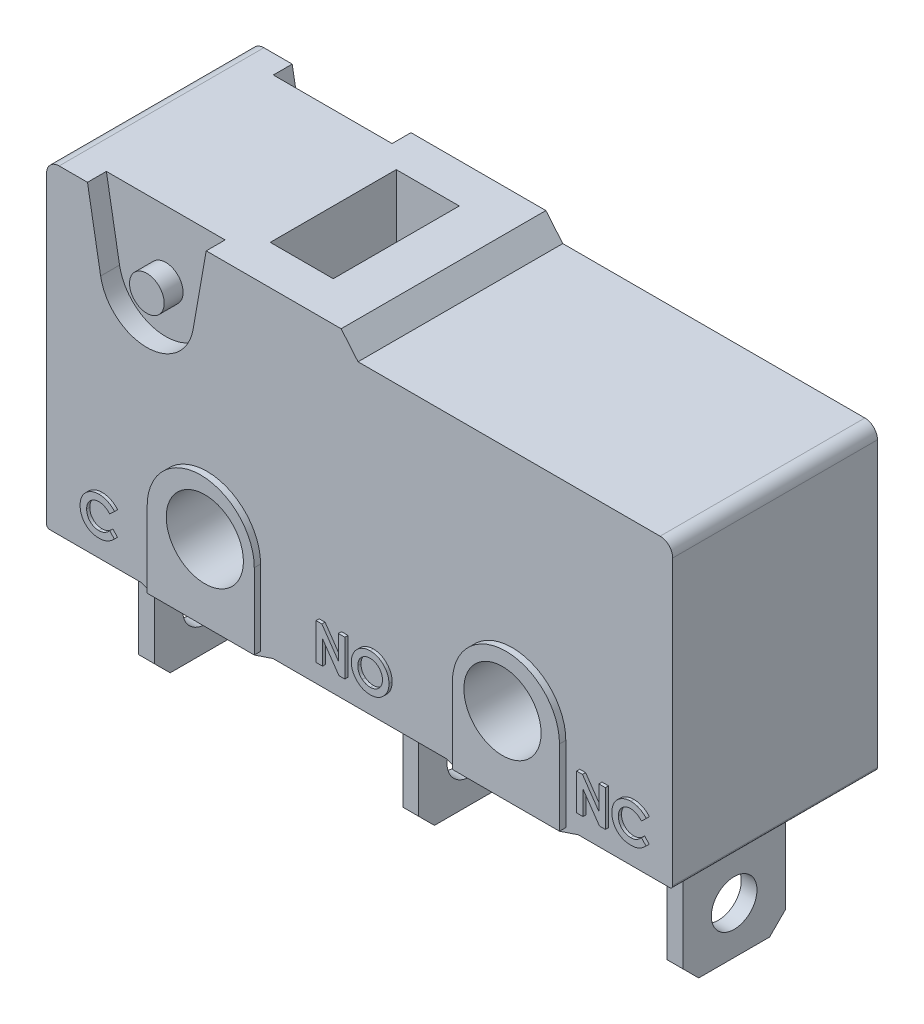
from build123d import *

# Parameters (mm, degrees)
BOSS_EXTRUDE1_DEPTH = 6.5
BOSS_EXTRUDE2_DEPTH = 0.2
SKETCH4_R           = 1.225
CUT_EXTRUDE1_DEPTH  = 10.2
FILLET1_R           = 0.1
SKETCH5_R           = 0.55
CUT_EXTRUDE2_DEPTH  = 0.6
SKETCH6_W           = 2
SKETCH6_H           = 4
CUT_EXTRUDE3_DEPTH  = 2
SKETCH7_W           = 0.5
SKETCH7_H           = 3.25
BOSS_EXTRUDE3_DEPTH = 4.15
CHAMFER1_SIZE       = 0.5
SKETCH8_R           = 0.725
CUT_EXTRUDE4_DEPTH  = 18.15
BOSS_EXTRUDE4_DEPTH = 0.1
BOSS_EXTRUDE5_DEPTH = 0.1
BOSS_EXTRUDE6_DEPTH = 0.1
BOSS_EXTRUDE7_DEPTH = 0.1
BOSS_EXTRUDE8_DEPTH = 0.1
BOSS_EXTRUDE9_DEPTH = 0.1


with BuildPart() as part:
    # Sketch1 → Boss-Extrude1 (new body)
    with BuildSketch(Plane.XY):
        with BuildLine():
            Line((9.352976236, 0), (9.89, -0.64))
            Line((9.89, -0.64), (19.48, -0.64))
            ThreePointArc((19.48, -0.64), (19.762842712, -0.757157288), (19.88, -1.04))
            Line((19.88, -1.04), (19.88, -10.15))
            Line((19.88, -10.15), (16.88, -10.15))
            Line((16.88, -10.15), (16.285, -10.35))
            Line((16.285, -10.35), (13.285, -10.35))
            Line((13.285, -10.35), (12.69, -10.15))
            Line((12.69, -10.15), (7.19, -10.15))
            Line((7.19, -10.15), (6.595, -10.35))
            Line((6.595, -10.35), (3.595, -10.35))
            Line((3.595, -10.35), (3, -10.15))
            Line((3, -10.15), (0, -10.15))
            Line((0, -10.15), (0, -0.4))
            ThreePointArc((0, -0.4), (0.117157288, -0.117157288), (0.4, 0))
            Line((0.4, 0), (9.352976236, 0))
        make_face()
    extrude(amount=BOSS_EXTRUDE1_DEPTH)

    # Sketch3 → Boss-Extrude2 (add)
    with BuildSketch(Plane.XY.offset(6.5)):
        with BuildLine():
            Line((3.395, -7.75), (3.395, -10.15))
            Line((3.395, -10.15), (6.795, -10.15))
            Line((6.795, -10.15), (6.795, -7.75))
            ThreePointArc((6.795, -7.75), (5.095, -6.05), (3.395, -7.75))
        make_face()
        with BuildLine():
            Line((13.085, -7.75), (13.085, -10.15))
            Line((13.085, -10.15), (16.485, -10.15))
            Line((16.485, -10.15), (16.485, -7.75))
            ThreePointArc((16.485, -7.75), (14.785, -6.05), (13.085, -7.75))
        make_face()
    boss_extrude2 = extrude(amount=BOSS_EXTRUDE2_DEPTH)

    # Mirror1: Boss-Extrude2 across plane
    add(boss_extrude2.mirror(Plane.XY.offset(3.25)))

    # Sketch4 → Cut-Extrude1 (cut)
    with BuildSketch(Plane.XY.offset(6.7)):
        with Locations((5.225191111, -7.750594536)):
            Circle(SKETCH4_R)
        with Locations((14.675191092, -7.750006829)):
            Circle(SKETCH4_R)
    extrude(amount=-CUT_EXTRUDE1_DEPTH, mode=Mode.SUBTRACT)

    # Fillet1
    fillet1_edges = [part.edges().sort_by_distance(p)[0] for p in [
        (19.88, -10.15, 3.25),
        (0, -10.15, 3.25),
    ]]
    fillet(fillet1_edges, radius=FILLET1_R)

    # Sketch5 → Cut-Extrude2 (cut)
    with BuildSketch(Plane.XY.offset(6.5)):
        with BuildLine():
            Line((1.717678208, -2.368770825), (1.3, 0))
            Line((1.3, 0), (5.07, 0))
            Line((5.07, 0), (4.652321792, -2.368770825))
            ThreePointArc((4.652321792, -2.368770825), (3.185, -3.6), (1.717678208, -2.368770825))
        make_face()
        with Locations((3.185, -2.110042404)):
            Circle(SKETCH5_R, mode=Mode.SUBTRACT)
    cut_extrude2 = extrude(amount=-CUT_EXTRUDE2_DEPTH, mode=Mode.SUBTRACT)

    # Mirror2: Cut-Extrude2 across plane
    add(cut_extrude2.mirror(Plane.XY.offset(3.25)), mode=Mode.SUBTRACT)

    # Sketch6 → Cut-Extrude3 (cut)
    with BuildSketch(Plane(origin=(0, 0, 0), x_dir=(1, 0, 0), z_dir=(0, 1, 0))):
        with Locations((6.852976236, -3.25)):
            Rectangle(SKETCH6_W, SKETCH6_H)
    extrude(amount=-CUT_EXTRUDE3_DEPTH, mode=Mode.SUBTRACT)

    # Sketch7 → Boss-Extrude3 (add)
    with BuildSketch(Plane.XZ.offset(10.15)):
        with Locations((1.55, 3.25)):
            Rectangle(SKETCH7_W, SKETCH7_H)
        with Locations((9.94, 3.25)):
            Rectangle(SKETCH7_W, SKETCH7_H)
        with Locations((18.33, 3.25)):
            Rectangle(SKETCH7_W, SKETCH7_H)
    extrude(amount=BOSS_EXTRUDE3_DEPTH)

    # Chamfer1
    chamfer1_edges = [part.edges().sort_by_distance(p)[0] for p in [
        (1.55, -14.3, 4.875),
        (9.94, -14.3, 4.875),
        (18.33, -14.3, 4.875),
        (18.33, -14.3, 1.625),
        (9.94, -14.3, 1.625),
        (1.55, -14.3, 1.625),
    ]]
    chamfer(chamfer1_edges, length=CHAMFER1_SIZE)

    # Sketch8 → Cut-Extrude4 (cut)
    with BuildSketch(Plane.ZY.offset(-1.3)):
        with Locations((3.25, -12.8)):
            Circle(SKETCH8_R)
    extrude(amount=-CUT_EXTRUDE4_DEPTH, mode=Mode.SUBTRACT)

    # Sketch9 → Boss-Extrude4 (add)
    # profile 1 of 5: a face of its own
    with BuildSketch(Plane.XY.offset(6.5)):
        with BuildLine():
            Line((2.257577475, -8.522307291), (2.106225312, -8.666978765))
            add(Edge.make_bspline(
                [(2.106225312, -8.666978765), (2.093386388, -8.653703296), (2.068307948, -8.627772147), (2.027897144, -8.593441591), (1.985871379, -8.564831718), (1.94304818, -8.540736665), (1.898657283, -8.52250704), (1.853211966, -8.509222805), (1.806422049, -8.501123909), (1.774756433, -8.500197252), (1.758829479, -8.499731169)],
                knots=[0, 0, 0, 0, 1.115251505, 2.178435587, 3.19620269, 4.182487026, 5.141301733, 6.088180966, 7.038406374, 8, 8, 8, 8], degree=3))
            add(Edge.make_bspline(
                [(1.758829479, -8.499731169), (1.745528536, -8.500099391), (1.719280592, -8.500826037), (1.680741731, -8.506153071), (1.643877319, -8.515211923), (1.608561163, -8.527696699), (1.574897182, -8.543851336), (1.542814796, -8.563663332), (1.512393102, -8.586953756), (1.484033954, -8.613602102), (1.458092001, -8.642717422), (1.435170634, -8.6737834), (1.415970313, -8.706728863), (1.400212921, -8.741220166), (1.387938523, -8.777416951), (1.37917306, -8.815294849), (1.37410335, -8.85489897), (1.373346662, -8.881821556), (1.372962091, -8.895504406)],
                knots=[0, 0, 0, 0, 1.035432265, 2.043311493, 3.022114605, 3.98653278, 4.95457646, 5.923598177, 6.917315552, 7.932509744, 8.948865224, 9.949768934, 10.933144597, 11.912367597, 12.897413939, 13.903909035, 14.934704909, 16, 16, 16, 16], degree=3))
            add(Edge.make_bspline(
                [(1.372962091, -8.895504406), (1.37307292, -8.905107988), (1.373291366, -8.924036844), (1.375682647, -8.952037877), (1.379533173, -8.979205498), (1.385105838, -9.005498556), (1.392074511, -9.030939838), (1.400250351, -9.055748822), (1.410506821, -9.079582706), (1.421891658, -9.102718305), (1.435132093, -9.124524334), (1.449407724, -9.145318192), (1.464887315, -9.16499795), (1.481671128, -9.183483157), (1.499995375, -9.20048493), (1.519386441, -9.216514532), (1.540171427, -9.231170689), (1.561918577, -9.244821213), (1.584815758, -9.256679539), (1.608241716, -9.267420892), (1.632551637, -9.276144467), (1.657449532, -9.283176464), (1.682846425, -9.289156128), (1.708990721, -9.292837991), (1.735655782, -9.295626222), (1.753676888, -9.295798379), (1.762745745, -9.295885015)],
                knots=[0, 0, 0, 0, 1.103660481, 2.175337485, 3.227646561, 4.255952547, 5.262355991, 6.258840057, 7.255597736, 8.242457506, 9.22035537, 10.185017736, 11.140346927, 12.096287581, 13.051739095, 14.01125915, 14.986044842, 15.97314143, 16.960198552, 17.947847494, 18.933482797, 19.925264591, 20.920966487, 21.929612487, 22.958107872, 24, 24, 24, 24], degree=3))
            add(Edge.make_bspline(
                [(1.762745745, -9.295885015), (1.778128085, -9.295440076), (1.808350382, -9.294565887), (1.85270595, -9.287729851), (1.894972387, -9.276484958), (1.928743068, -9.263205394), (1.955201504, -9.250091651), (1.975343921, -9.237962085), (1.996172749, -9.224393834), (2.017342041, -9.208874817), (2.039089908, -9.191591269), (2.061032451, -9.172164647), (2.083731402, -9.151234643), (2.09860126, -9.136296487), (2.106225312, -9.128637419)],
                knots=[0, 0, 0, 0, 1.404581149, 2.759636711, 4.088442092, 5.392261763, 6.066678138, 6.783632037, 7.538459478, 8.336747902, 9.180226004, 10.074962426, 11.012997595, 12, 12, 12, 12], degree=3))
            Line((2.106225312, -9.128637419), (2.252970104, -9.282754005))
            add(Edge.make_bspline(
                [(2.252970104, -9.282754005), (2.242654735, -9.29271317), (2.22252134, -9.31215133), (2.192150674, -9.339751704), (2.16181823, -9.364553707), (2.132256778, -9.387457546), (2.10298207, -9.407795974), (2.07399721, -9.425589304), (2.04563032, -9.441287555), (2.017292352, -9.454625984), (1.988806972, -9.465951696), (1.959498864, -9.475702391), (1.92927843, -9.483951127), (1.897961098, -9.490606774), (1.865838975, -9.495943705), (1.832611442, -9.499546102), (1.798489178, -9.501967874), (1.775343518, -9.50218549), (1.763667219, -9.502295271)],
                knots=[0, 0, 0, 0, 1.244526981, 2.429050516, 3.560637417, 4.644440555, 5.67424972, 6.652764056, 7.595344123, 8.486817594, 9.369275933, 10.254498637, 11.166417451, 12.086725134, 13.032340136, 13.991389299, 14.986715468, 16, 16, 16, 16], degree=3))
            add(Edge.make_bspline(
                [(1.763667219, -9.502295271), (1.742219304, -9.501748521), (1.700251695, -9.500678683), (1.638749259, -9.492751908), (1.580323596, -9.479462808), (1.524832567, -9.460668356), (1.472293817, -9.436659324), (1.422720786, -9.407225379), (1.376193377, -9.372444721), (1.333087437, -9.332725014), (1.294096064, -9.288857931), (1.259632205, -9.24175672), (1.2311237, -9.191189893), (1.207452473, -9.137904485), (1.188941886, -9.081657334), (1.17591357, -9.022387598), (1.167879103, -8.960152504), (1.167000121, -8.917644501), (1.166551834, -8.895965143)],
                knots=[0, 0, 0, 0, 1.078019885, 2.10938526, 3.111377082, 4.085535484, 5.04941344, 6.010039228, 6.978205633, 7.964457913, 8.951525778, 9.924444315, 10.892603023, 11.863865945, 12.85144698, 13.863884204, 14.910567087, 16, 16, 16, 16], degree=3))
            add(Edge.make_bspline(
                [(1.166551834, -8.895965143), (1.166741259, -8.881826051), (1.167116651, -8.853805826), (1.17106206, -8.812529765), (1.17656219, -8.772292989), (1.185287646, -8.733513288), (1.195805323, -8.695668229), (1.208885436, -8.659169144), (1.224507094, -8.623911129), (1.242166775, -8.589835162), (1.262144995, -8.557164476), (1.28446286, -8.526179764), (1.308545821, -8.496641829), (1.334972553, -8.468942548), (1.36335904, -8.442838715), (1.393833444, -8.418471792), (1.426212477, -8.395492329), (1.460583776, -8.374492912), (1.4962796, -8.355497823), (1.532849729, -8.338743343), (1.570204316, -8.324740456), (1.608185421, -8.313125578), (1.646953515, -8.304455893), (1.68623188, -8.297893221), (1.726354728, -8.294224645), (1.753293744, -8.293624076), (1.766892379, -8.293320912)],
                knots=[0, 0, 0, 0, 1.071919942, 2.124283339, 3.142214191, 4.149696895, 5.136002878, 6.119640489, 7.086990633, 8.058538607, 9.028339693, 9.988281803, 10.952401235, 11.916291999, 12.888973767, 13.874849856, 14.873389453, 15.898127285, 16.927174885, 17.938320013, 18.946391617, 19.950418109, 20.947802303, 21.956882652, 22.968648068, 24, 24, 24, 24], degree=3))
            add(Edge.make_bspline(
                [(1.766892379, -8.293320912), (1.778493409, -8.293494693), (1.80157485, -8.293840448), (1.83594699, -8.29672269), (1.870044237, -8.301249221), (1.903744513, -8.308078794), (1.937288877, -8.316186359), (1.970236519, -8.326802098), (2.003107205, -8.338635339), (2.035385407, -8.352779563), (2.067116181, -8.368219261), (2.097556184, -8.385736159), (2.1272165, -8.404252286), (2.155439875, -8.424863509), (2.182754994, -8.44682222), (2.209019022, -8.470230868), (2.234001478, -8.495479745), (2.249679081, -8.513319567), (2.257577475, -8.522307291)],
                knots=[0, 0, 0, 0, 0.996412454, 1.982464992, 2.961075852, 3.949442424, 4.934965278, 5.923860011, 6.921385422, 7.934793307, 8.949617135, 9.951082467, 10.950285876, 11.951772932, 12.951063433, 13.960125323, 14.972308753, 16, 16, 16, 16], degree=3))
        make_face()
    # profile 2 of 5: a face of its own
    with BuildSketch(Plane.XY.offset(6.5)):
        Polygon((8.656295424, -8.322808092), (8.842202876, -8.322808092), (9.363987732, -9.079568909), (9.363987732, -8.322808092), (9.570397988, -8.322808092), (9.570397988, -9.472808092), (9.383108325, -9.472808092), (8.862705681, -8.71835096), (8.862705681, -9.472808092), (8.656295424, -9.472808092), align=None)
    # profile 3 of 5: a face of its own
    with BuildSketch(Plane.XY.offset(6.5)):
        with BuildLine():
            add(Edge.make_bspline(
                [(10.376227315, -8.293320912), (10.396221475, -8.293838597), (10.435694474, -8.294860624), (10.493745011, -8.303380013), (10.549687438, -8.317261137), (10.603496456, -8.336556904), (10.655037335, -8.36178994), (10.704491876, -8.392244873), (10.751682935, -8.428496522), (10.796126936, -8.469699194), (10.837201209, -8.514505302), (10.872792091, -8.562747042), (10.903142689, -8.613174423), (10.928297346, -8.665922568), (10.947457299, -8.721356781), (10.960902631, -8.779194422), (10.96954059, -8.839419036), (10.970534089, -8.880423789), (10.971039014, -8.901263621)],
                knots=[0, 0, 0, 0, 1.014329547, 2.002516266, 2.970391464, 3.935626869, 4.897733899, 5.877609409, 6.878433252, 7.912639331, 8.949961323, 9.958554974, 10.949718813, 11.932905612, 12.9188844, 13.919928257, 14.942845884, 16, 16, 16, 16], degree=3))
            add(Edge.make_bspline(
                [(10.971039014, -8.901263621), (10.97050129, -8.921868635), (10.969441689, -8.962471477), (10.96125527, -9.022141098), (10.947583517, -9.079359177), (10.928748532, -9.134255229), (10.904050085, -9.186563356), (10.874291357, -9.236617539), (10.83868707, -9.283953263), (10.798535854, -9.328545125), (10.754332849, -9.369021808), (10.70751485, -9.404691815), (10.658298033, -9.434917233), (10.606754435, -9.459684217), (10.552773525, -9.478904961), (10.496488642, -9.492466593), (10.437903268, -9.500708271), (10.398062372, -9.501760951), (10.377839895, -9.502295271)],
                knots=[0, 0, 0, 0, 1.051557043, 2.072126891, 3.067553643, 4.050577992, 5.02905126, 6.015227836, 7.017913613, 8.04756643, 9.074058332, 10.072836633, 11.047628519, 12.017157415, 12.98668631, 13.966869689, 14.968021931, 16, 16, 16, 16], degree=3))
            add(Edge.make_bspline(
                [(10.377839895, -9.502295271), (10.356689609, -9.50181596), (10.315132189, -9.500874178), (10.254312717, -9.49191826), (10.196042409, -9.47842752), (10.140810767, -9.458293315), (10.088055304, -9.433123865), (10.038163631, -9.402126179), (9.991152515, -9.365351481), (9.947291618, -9.323741587), (9.907553539, -9.278211237), (9.87247689, -9.230112459), (9.842888959, -9.179812686), (9.818788662, -9.127288378), (9.799788956, -9.072865958), (9.786386823, -9.01621398), (9.778469862, -8.957468316), (9.777367076, -8.917567086), (9.776808245, -8.897347355)],
                knots=[0, 0, 0, 0, 1.067978421, 2.098431617, 3.099715153, 4.085208694, 5.062210972, 6.048429807, 7.046490867, 8.072918869, 9.098532598, 10.095778865, 11.076610158, 12.041847152, 13.011192615, 13.984257998, 14.978533688, 16, 16, 16, 16], degree=3))
            add(Edge.make_bspline(
                [(9.776808245, -8.897347355), (9.776983638, -8.883744578), (9.777332204, -8.856711267), (9.781531048, -8.816649279), (9.787576175, -8.777369248), (9.796516632, -8.739027783), (9.807377002, -8.701354403), (9.821448145, -8.664699782), (9.837464914, -8.628672346), (9.856179001, -8.593697626), (9.876987255, -8.560097417), (9.899690914, -8.528030218), (9.924347065, -8.497883769), (9.950876281, -8.469459958), (9.979369987, -8.442945619), (10.009453378, -8.417965403), (10.041709895, -8.395182874), (10.075433545, -8.374041637), (10.110434202, -8.354923983), (10.146569381, -8.338651607), (10.183094626, -8.324441219), (10.220497866, -8.313225752), (10.258378257, -8.304090872), (10.297140476, -8.298049819), (10.336434327, -8.293851092), (10.362931507, -8.293498058), (10.376227315, -8.293320912)],
                knots=[0, 0, 0, 0, 1.034744296, 2.056386356, 3.06226378, 4.057406941, 5.050368692, 6.043467995, 7.042652155, 8.049140477, 9.059438543, 10.048523776, 11.036952808, 12.020949711, 13.004946614, 13.997082645, 14.994316842, 16.007702937, 17.024872941, 18.026463647, 19.021641123, 20.005082605, 20.995858141, 21.984425357, 22.988620895, 24, 24, 24, 24], degree=3))
        make_face()
        with BuildLine():
            add(Edge.make_bspline(
                [(10.373002155, -8.499731169), (10.359546088, -8.500092225), (10.332989197, -8.500804806), (10.294035075, -8.50623371), (10.256637742, -8.514904286), (10.221004506, -8.527463509), (10.18698093, -8.543448213), (10.154506701, -8.562802545), (10.124031519, -8.586191788), (10.095149028, -8.612360278), (10.069058449, -8.64151799), (10.0460066, -8.672765438), (10.026715916, -8.706050438), (10.010559847, -8.74106378), (9.998397907, -8.778199182), (9.989735322, -8.817165756), (9.984260892, -8.858030644), (9.983570833, -8.885888185), (9.983218501, -8.900111778)],
                knots=[0, 0, 0, 0, 1.033739768, 2.040188636, 3.016340934, 3.979330865, 4.937572243, 5.900995986, 6.878200029, 7.884839167, 8.891893314, 9.879764717, 10.863503415, 11.843163062, 12.837761627, 13.859916423, 14.907309254, 16, 16, 16, 16], degree=3))
            add(Edge.make_bspline(
                [(9.983218501, -8.900111778), (9.98368564, -8.915874718), (9.984601155, -8.946767469), (9.99104283, -8.991832983), (10.002063894, -9.034392887), (10.017978097, -9.074239029), (10.037715884, -9.11181387), (10.062227082, -9.146656876), (10.091114727, -9.178976671), (10.113369534, -9.197846314), (10.124664815, -9.207423476)],
                knots=[0, 0, 0, 0, 1.078454662, 2.113592447, 3.107694534, 4.079536787, 5.043276885, 6.005368276, 6.987637804, 8, 8, 8, 8], degree=3))
            add(Edge.make_bspline(
                [(10.124664815, -9.207423476), (10.133917807, -9.214498717), (10.152215318, -9.22848979), (10.18142213, -9.246422222), (10.211499396, -9.261792104), (10.242674085, -9.274210787), (10.274880359, -9.283979115), (10.308113801, -9.290819714), (10.342327323, -9.295112782), (10.365464109, -9.295625885), (10.37714879, -9.295885015)],
                knots=[0, 0, 0, 0, 1.023928204, 2.024787132, 3.009472467, 3.9914905, 4.972207045, 5.96565515, 6.972602802, 8, 8, 8, 8], degree=3))
            add(Edge.make_bspline(
                [(10.37714879, -9.295885015), (10.390373479, -9.295520897), (10.416393471, -9.294804484), (10.454622441, -9.289442413), (10.491246956, -9.280367853), (10.526494383, -9.267918804), (10.560263085, -9.251733398), (10.592388025, -9.231778756), (10.622925526, -9.208299894), (10.651771221, -9.181787754), (10.67813755, -9.152515181), (10.701141295, -9.121101063), (10.721045327, -9.088237547), (10.73686543, -9.0534595), (10.74950786, -9.017095211), (10.758066187, -8.978983631), (10.763586863, -8.939281868), (10.764277116, -8.912263416), (10.764628757, -8.898499198)],
                knots=[0, 0, 0, 0, 1.026359118, 2.019393844, 2.989460624, 3.950973911, 4.916101784, 5.890408035, 6.881132271, 7.902007068, 8.92769091, 9.933912415, 10.920395702, 11.90457117, 12.894218921, 13.903490204, 14.931958862, 16, 16, 16, 16], degree=3))
            add(Edge.make_bspline(
                [(10.764628757, -8.898499198), (10.76426495, -8.884814127), (10.763548849, -8.857877154), (10.758177341, -8.818277464), (10.74916033, -8.780334135), (10.736673897, -8.7439852), (10.720729384, -8.709195024), (10.701012376, -8.676085951), (10.677592058, -8.644689987), (10.651007446, -8.615221086), (10.62207173, -8.588141053), (10.591006348, -8.564640507), (10.558680544, -8.54421928), (10.524352606, -8.528222115), (10.488724855, -8.515477208), (10.451579888, -8.506091675), (10.412777018, -8.500842945), (10.386378623, -8.500105064), (10.373002155, -8.499731169)],
                knots=[0, 0, 0, 0, 1.055025985, 2.07665775, 3.074803781, 4.057872707, 5.035505728, 6.020516407, 7.023567878, 8.050795229, 9.077271434, 10.074415901, 11.050397877, 12.019801805, 12.988065821, 13.964604439, 14.968634123, 16, 16, 16, 16], degree=3))
        make_face(mode=Mode.SUBTRACT)
    # profile 4 of 5: a face of its own
    with BuildSketch(Plane.XY.offset(6.5)):
        Polygon((16.92744927, -8.322808092), (17.113356722, -8.322808092), (17.635141578, -9.079568909), (17.635141578, -8.322808092), (17.841551834, -8.322808092), (17.841551834, -9.472808092), (17.654262171, -9.472808092), (17.133859527, -8.71835096), (17.133859527, -9.472808092), (16.92744927, -9.472808092), align=None)
    # profile 5 of 5: a face of its own
    with BuildSketch(Plane.XY.offset(6.5)):
        with BuildLine():
            Line((19.138987732, -8.522307291), (18.987635568, -8.666978765))
            add(Edge.make_bspline(
                [(18.987635568, -8.666978765), (18.974796645, -8.653703296), (18.949718205, -8.627772147), (18.9093074, -8.593441591), (18.867281635, -8.564831718), (18.824458436, -8.540736665), (18.780067539, -8.52250704), (18.734622223, -8.509222805), (18.687832306, -8.501123909), (18.656166689, -8.500197252), (18.640239735, -8.499731169)],
                knots=[0, 0, 0, 0, 1.115251505, 2.178435587, 3.19620269, 4.182487026, 5.141301733, 6.088180966, 7.038406374, 8, 8, 8, 8], degree=3))
            add(Edge.make_bspline(
                [(18.640239735, -8.499731169), (18.626938793, -8.500099391), (18.600690848, -8.500826037), (18.562151987, -8.506153071), (18.525287575, -8.515211923), (18.489971419, -8.527696699), (18.456307438, -8.543851336), (18.424225052, -8.563663332), (18.393803358, -8.586953756), (18.36544421, -8.613602102), (18.339502258, -8.642717422), (18.316580891, -8.6737834), (18.297380569, -8.706728863), (18.281623178, -8.741220166), (18.269348779, -8.777416951), (18.260583316, -8.815294849), (18.255513606, -8.85489897), (18.254756918, -8.881821556), (18.254372347, -8.895504406)],
                knots=[0, 0, 0, 0, 1.035432265, 2.043311493, 3.022114605, 3.98653278, 4.95457646, 5.923598177, 6.917315552, 7.932509744, 8.948865224, 9.949768934, 10.933144597, 11.912367597, 12.897413939, 13.903909035, 14.934704909, 16, 16, 16, 16], degree=3))
            add(Edge.make_bspline(
                [(18.254372347, -8.895504406), (18.254483176, -8.905107988), (18.254701623, -8.924036844), (18.257092903, -8.952037877), (18.260943429, -8.979205498), (18.266516095, -9.005498556), (18.273484767, -9.030939838), (18.281660607, -9.055748822), (18.291917078, -9.079582706), (18.303301915, -9.102718305), (18.316542349, -9.124524334), (18.33081798, -9.145318192), (18.346297571, -9.16499795), (18.363081384, -9.183483157), (18.381405631, -9.20048493), (18.400796697, -9.216514532), (18.421581684, -9.231170689), (18.443328834, -9.244821213), (18.466226014, -9.256679539), (18.489651973, -9.267420892), (18.513961893, -9.276144467), (18.538859788, -9.283176464), (18.564256681, -9.289156128), (18.590400977, -9.292837991), (18.617066039, -9.295626222), (18.635087144, -9.295798379), (18.644156001, -9.295885015)],
                knots=[0, 0, 0, 0, 1.103660481, 2.175337485, 3.227646561, 4.255952547, 5.262355991, 6.258840057, 7.255597736, 8.242457506, 9.22035537, 10.185017736, 11.140346927, 12.096287581, 13.051739095, 14.01125915, 14.986044842, 15.97314143, 16.960198552, 17.947847494, 18.933482797, 19.925264591, 20.920966487, 21.929612487, 22.958107872, 24, 24, 24, 24], degree=3))
            add(Edge.make_bspline(
                [(18.644156001, -9.295885015), (18.659538341, -9.295440076), (18.689760639, -9.294565887), (18.734116206, -9.287729851), (18.776382643, -9.276484958), (18.810153324, -9.263205394), (18.836611761, -9.250091651), (18.856754177, -9.237962085), (18.877583006, -9.224393834), (18.898752298, -9.208874817), (18.920500165, -9.191591269), (18.942442708, -9.172164647), (18.965141659, -9.151234643), (18.980011517, -9.136296487), (18.987635568, -9.128637419)],
                knots=[0, 0, 0, 0, 1.404581149, 2.759636711, 4.088442092, 5.392261763, 6.066678138, 6.783632037, 7.538459478, 8.336747902, 9.180226004, 10.074962426, 11.012997595, 12, 12, 12, 12], degree=3))
            Line((18.987635568, -9.128637419), (19.13438036, -9.282754005))
            add(Edge.make_bspline(
                [(19.13438036, -9.282754005), (19.124064991, -9.29271317), (19.103931597, -9.31215133), (19.07356093, -9.339751704), (19.043228487, -9.364553707), (19.013667035, -9.387457546), (18.984392326, -9.407795974), (18.955407466, -9.425589304), (18.927040576, -9.441287555), (18.898702608, -9.454625984), (18.870217229, -9.465951696), (18.840909121, -9.475702391), (18.810688687, -9.483951127), (18.779371354, -9.490606774), (18.747249232, -9.495943705), (18.714021699, -9.499546102), (18.679899435, -9.501967874), (18.656753775, -9.50218549), (18.645077475, -9.502295271)],
                knots=[0, 0, 0, 0, 1.244526981, 2.429050516, 3.560637417, 4.644440555, 5.67424972, 6.652764056, 7.595344123, 8.486817594, 9.369275933, 10.254498637, 11.166417451, 12.086725134, 13.032340136, 13.991389299, 14.986715468, 16, 16, 16, 16], degree=3))
            add(Edge.make_bspline(
                [(18.645077475, -9.502295271), (18.62362956, -9.501748521), (18.581661952, -9.500678683), (18.520159516, -9.492751908), (18.461733853, -9.479462808), (18.406242823, -9.460668356), (18.353704073, -9.436659324), (18.304131043, -9.407225379), (18.257603633, -9.372444721), (18.214497694, -9.332725014), (18.17550632, -9.288857931), (18.141042461, -9.24175672), (18.112533956, -9.191189893), (18.08886273, -9.137904485), (18.070352142, -9.081657334), (18.057323827, -9.022387598), (18.04928936, -8.960152504), (18.048410377, -8.917644501), (18.047962091, -8.895965143)],
                knots=[0, 0, 0, 0, 1.078019885, 2.10938526, 3.111377082, 4.085535484, 5.04941344, 6.010039228, 6.978205633, 7.964457913, 8.951525778, 9.924444315, 10.892603023, 11.863865945, 12.85144698, 13.863884204, 14.910567087, 16, 16, 16, 16], degree=3))
            add(Edge.make_bspline(
                [(18.047962091, -8.895965143), (18.048151515, -8.881826051), (18.048526907, -8.853805826), (18.052472317, -8.812529765), (18.057972447, -8.772292989), (18.066697903, -8.733513288), (18.077215579, -8.695668229), (18.090295692, -8.659169144), (18.10591735, -8.623911129), (18.123577031, -8.589835162), (18.143555251, -8.557164476), (18.165873116, -8.526179764), (18.189956078, -8.496641829), (18.216382809, -8.468942548), (18.244769296, -8.442838715), (18.2752437, -8.418471792), (18.307622733, -8.395492329), (18.341994033, -8.374492912), (18.377689856, -8.355497823), (18.414259986, -8.338743343), (18.451614572, -8.324740456), (18.489595677, -8.313125578), (18.528363771, -8.304455893), (18.567642136, -8.297893221), (18.607764984, -8.294224645), (18.634704001, -8.293624076), (18.648302636, -8.293320912)],
                knots=[0, 0, 0, 0, 1.071919942, 2.124283339, 3.142214191, 4.149696895, 5.136002878, 6.119640489, 7.086990633, 8.058538607, 9.028339693, 9.988281803, 10.952401235, 11.916291999, 12.888973767, 13.874849856, 14.873389453, 15.898127285, 16.927174885, 17.938320013, 18.946391617, 19.950418109, 20.947802303, 21.956882652, 22.968648068, 24, 24, 24, 24], degree=3))
            add(Edge.make_bspline(
                [(18.648302636, -8.293320912), (18.659903666, -8.293494693), (18.682985107, -8.293840448), (18.717357246, -8.29672269), (18.751454493, -8.301249221), (18.78515477, -8.308078794), (18.818699134, -8.316186359), (18.851646775, -8.326802098), (18.884517461, -8.338635339), (18.916795663, -8.352779563), (18.948526438, -8.368219261), (18.97896644, -8.385736159), (19.008626757, -8.404252286), (19.036850132, -8.424863509), (19.06416525, -8.44682222), (19.090429279, -8.470230868), (19.115411735, -8.495479745), (19.131089337, -8.513319567), (19.138987732, -8.522307291)],
                knots=[0, 0, 0, 0, 0.996412454, 1.982464992, 2.961075852, 3.949442424, 4.934965278, 5.923860011, 6.921385422, 7.934793307, 8.949617135, 9.951082467, 10.950285876, 11.951772932, 12.951063433, 13.960125323, 14.972308753, 16, 16, 16, 16], degree=3))
        make_face()
    extrude(amount=BOSS_EXTRUDE4_DEPTH)

    # Sketch11 → Boss-Extrude5 (add)
    with BuildSketch(Plane(origin=(0, 0, 0), x_dir=(-1, 0, 0), z_dir=(0, 0, -1))):
        Polygon((-18.832232526, -0.929337472), (-18.672488937, -0.929337472), (-18.672488937, -1.607178016), (-17.930465699, -0.929337472), (-17.702617142, -0.929337472), (-18.57728461, -1.72805542), (-17.634155603, -2.709337472), (-17.847028199, -2.709337472), (-18.672488937, -1.850359106), (-18.672488937, -2.709337472), (-18.832232526, -2.709337472), align=None)
        Polygon((-17.48582227, -0.929337472), (-17.320730122, -0.929337472), (-16.972360731, -2.234742119), (-16.454263776, -0.929337472), (-16.431086693, -0.929337472), (-15.922617142, -2.225827856), (-15.572464898, -0.929337472), (-15.409155603, -0.929337472), (-15.889099514, -2.709337472), (-15.911920026, -2.709337472), (-16.447488937, -1.347951254), (-16.989476116, -2.709337472), (-17.012296629, -2.709337472), align=None)
        with BuildLine():
            Line((-8.654283808, -1.255956061), (-8.794059449, -1.362927215))
            add(Edge.make_bspline(
                [(-8.794059449, -1.362927215), (-8.804030444, -1.351043951), (-8.823838003, -1.327437633), (-8.855704683, -1.294289179), (-8.888915233, -1.263233132), (-8.923456957, -1.234121548), (-8.959951595, -1.20797245), (-8.997515087, -1.183423146), (-9.036775807, -1.161418411), (-9.091066689, -1.134737235), (-9.162087595, -1.106894904), (-9.251491827, -1.083549833), (-9.344820329, -1.068688777), (-9.408492251, -1.06707923), (-9.44087836, -1.066260548)],
                knots=[0, 0, 0, 0, 0.757959112, 1.505699292, 2.245454638, 2.979532153, 3.711538275, 4.438200793, 5.171680507, 5.909471876, 7.393775596, 8.890124382, 10.418191784, 12, 12, 12, 12], degree=3))
            add(Edge.make_bspline(
                [(-9.44087836, -1.066260548), (-9.458720723, -1.066465992), (-9.494239857, -1.066874973), (-9.546952509, -1.072270471), (-9.598680861, -1.079853887), (-9.649391263, -1.091106194), (-9.699019168, -1.105332269), (-9.747889018, -1.122331479), (-9.795293266, -1.143363369), (-9.841887684, -1.166609284), (-9.886529683, -1.192865527), (-9.928769108, -1.221504889), (-9.968451903, -1.252206887), (-10.00560946, -1.285086592), (-10.040279765, -1.319995932), (-10.072211597, -1.35730694), (-10.101294463, -1.396900331), (-10.128104836, -1.438254007), (-10.152115883, -1.481247513), (-10.17221965, -1.526039977), (-10.190022255, -1.57186435), (-10.204109299, -1.619238368), (-10.215259481, -1.667828689), (-10.222952979, -1.717765719), (-10.228287116, -1.768945133), (-10.228694063, -1.80363444), (-10.228899193, -1.821120324)],
                knots=[0, 0, 0, 0, 1.054917814, 2.100044995, 3.131103042, 4.146048494, 5.169673617, 6.183595914, 7.203665975, 8.234915748, 9.262203917, 10.264457458, 11.251630812, 12.227803204, 13.197192746, 14.159520551, 15.12972552, 16.100847026, 17.073214652, 18.039054194, 19.002613845, 19.979014051, 20.95965708, 21.949030935, 22.966165397, 24, 24, 24, 24], degree=3))
            add(Edge.make_bspline(
                [(-10.228899193, -1.821120324), (-10.228257468, -1.847429395), (-10.226997526, -1.899083767), (-10.215784373, -1.974744249), (-10.198744641, -2.047226192), (-10.173206433, -2.116076512), (-10.141716173, -2.182144191), (-10.101925234, -2.244311379), (-10.055840252, -2.303517518), (-10.002809261, -2.35836336), (-9.944625732, -2.408464626), (-9.882199651, -2.452583493), (-9.815686499, -2.489360776), (-9.74582067, -2.519964543), (-9.672064532, -2.543489393), (-9.594550718, -2.560050576), (-9.513447818, -2.570853742), (-9.458029095, -2.571888018), (-9.429824674, -2.572414395)],
                knots=[0, 0, 0, 0, 1.029171465, 2.020641659, 2.987623507, 3.938342917, 4.889210282, 5.84687017, 6.821220943, 7.821438502, 8.827599549, 9.822697543, 10.807740252, 11.797342354, 12.80366471, 13.83203677, 14.896651826, 16, 16, 16, 16], degree=3))
            add(Edge.make_bspline(
                [(-9.429824674, -2.572414395), (-9.398749592, -2.57155553), (-9.337586397, -2.569865077), (-9.247890658, -2.555544088), (-9.162025611, -2.532323775), (-9.079986639, -2.499827118), (-9.002005019, -2.457582486), (-8.927958717, -2.406370422), (-8.857785233, -2.345703784), (-8.815588409, -2.299381508), (-8.794059449, -2.275747728)],
                knots=[0, 0, 0, 0, 1.028121516, 2.023589091, 2.998037872, 3.967518031, 4.937445131, 5.927275754, 6.942489185, 8, 8, 8, 8], degree=3))
            Line((-8.794059449, -2.275747728), (-8.654283808, -2.38164917))
            add(Edge.make_bspline(
                [(-8.654283808, -2.38164917), (-8.665532447, -2.396163012), (-8.687975844, -2.425121174), (-8.72431735, -2.465945072), (-8.762601233, -2.504344267), (-8.803111851, -2.540009171), (-8.845383185, -2.573653442), (-8.890174247, -2.604321231), (-8.936896212, -2.632440595), (-8.985390775, -2.658188002), (-9.035606413, -2.681031631), (-9.087482954, -2.700588118), (-9.140796789, -2.717434491), (-9.195550357, -2.731294047), (-9.251857227, -2.742111913), (-9.309514211, -2.749343633), (-9.368645748, -2.754298092), (-9.408538813, -2.754749661), (-9.428754962, -2.754978497)],
                knots=[0, 0, 0, 0, 0.986787822, 1.968848986, 2.935600012, 3.899624008, 4.868462664, 5.837806735, 6.815139263, 7.798259679, 8.787526145, 9.778297419, 10.776456485, 11.791383307, 12.812564526, 13.85620153, 14.913611965, 16, 16, 16, 16], degree=3))
            add(Edge.make_bspline(
                [(-9.428754962, -2.754978497), (-9.447899456, -2.754845255), (-9.485755321, -2.754581786), (-9.541646686, -2.750313769), (-9.59605853, -2.74449076), (-9.64883534, -2.735722922), (-9.700265121, -2.725376372), (-9.749881647, -2.71150699), (-9.798173154, -2.695970557), (-9.844945625, -2.677710306), (-9.890238843, -2.657104934), (-9.933906725, -2.633816655), (-9.975929184, -2.608041307), (-10.01671937, -2.580347044), (-10.055674712, -2.549844302), (-10.093132791, -2.5169567), (-10.12930365, -2.481795083), (-10.151682159, -2.456440329), (-10.162933648, -2.44369244)],
                knots=[0, 0, 0, 0, 1.114604814, 2.203992996, 3.262667896, 4.300477797, 5.318619304, 6.316056647, 7.298880507, 8.271930387, 9.238335007, 10.195173496, 11.151986948, 12.108099108, 13.064862484, 14.031167946, 15.010108607, 16, 16, 16, 16], degree=3))
            add(Edge.make_bspline(
                [(-10.162933648, -2.44369244), (-10.180955204, -2.421548635), (-10.216780744, -2.377528365), (-10.262616091, -2.306182923), (-10.301851134, -2.231693377), (-10.333573745, -2.153668385), (-10.358373078, -2.072283028), (-10.375553228, -1.98749628), (-10.386717187, -1.899387327), (-10.387993848, -1.839458903), (-10.388642783, -1.808996927)],
                knots=[0, 0, 0, 0, 0.994628077, 1.977248131, 2.950237994, 3.925870899, 4.908910175, 5.911660606, 6.938484602, 8, 8, 8, 8], degree=3))
            add(Edge.make_bspline(
                [(-10.388642783, -1.808996927), (-10.387851856, -1.776979582), (-10.386295756, -1.713987454), (-10.373075037, -1.621542415), (-10.351807192, -1.53297399), (-10.321599632, -1.448447514), (-10.283301482, -1.3675184), (-10.235990804, -1.290804873), (-10.180217229, -1.217816329), (-10.11641818, -1.149660255), (-10.046455364, -1.087340242), (-9.971533224, -1.032513087), (-9.891798405, -0.986885322), (-9.808129327, -0.948744416), (-9.719899466, -0.919428089), (-9.627297067, -0.898905611), (-9.530496133, -0.886131764), (-9.464451813, -0.884516944), (-9.430894385, -0.883696446)],
                knots=[0, 0, 0, 0, 1.032925535, 2.032216505, 3.007276963, 3.968222605, 4.92396291, 5.891752235, 6.871517503, 7.883894988, 8.900124299, 9.891468569, 10.874487609, 11.85992873, 12.854644235, 13.869047385, 14.917252991, 16, 16, 16, 16], degree=3))
            add(Edge.make_bspline(
                [(-9.430894385, -0.883696446), (-9.410442454, -0.883941648), (-9.369959915, -0.884427), (-9.310074281, -0.889159838), (-9.251770469, -0.897049615), (-9.195008312, -0.907788644), (-9.139511667, -0.921116939), (-9.085704688, -0.93847972), (-9.033271641, -0.958332584), (-8.982543214, -0.981197175), (-8.933762797, -1.006863118), (-8.886945583, -1.035045921), (-8.842463455, -1.065710645), (-8.800003412, -1.098596488), (-8.760275739, -1.134399184), (-8.722152473, -1.172133962), (-8.686928267, -1.212887735), (-8.665185214, -1.241573673), (-8.654283808, -1.255956061)],
                knots=[0, 0, 0, 0, 1.096760587, 2.17092713, 3.219439832, 4.250915756, 5.268269357, 6.278326846, 7.281116186, 8.274029601, 9.260640565, 10.235837813, 11.203064059, 12.156899882, 13.114053108, 14.069676657, 15.032185724, 16, 16, 16, 16], degree=3))
        make_face()
        Polygon((-8.289155603, -0.929337472), (-7.285053039, -0.929337472), (-7.285053039, -1.111901574), (-8.129412014, -1.111901574), (-8.129412014, -1.659593882), (-7.285053039, -1.659593882), (-7.285053039, -1.842157984), (-8.129412014, -1.842157984), (-8.129412014, -2.526773369), (-7.285053039, -2.526773369), (-7.285053039, -2.709337472), (-8.289155603, -2.709337472), align=None)
    extrude(amount=BOSS_EXTRUDE5_DEPTH)

    # Sketch12 → Boss-Extrude6 (add)
    # profile 1 of 9: a face of its own
    with BuildSketch(Plane(origin=(0, 0, 0), x_dir=(-1, 0, 0), z_dir=(0, 0, -1))):
        with BuildLine():
            Line((-16.960802951, -3.223041769), (-16.960802951, -3.356375102))
            Line((-16.960802951, -3.356375102), (-17.402990451, -3.356375102))
            Line((-17.402990451, -3.356375102), (-17.473042535, -3.698302186))
            add(Edge.make_bspline(
                [(-17.473042535, -3.698302186), (-17.459278924, -3.69450237), (-17.432614106, -3.687140829), (-17.393257586, -3.678967258), (-17.355894768, -3.674040093), (-17.33164963, -3.67336732), (-17.319917535, -3.673041769)],
                knots=[0, 0, 0, 0, 1.100273476, 2.13160584, 3.095893838, 4, 4, 4, 4], degree=3))
            add(Edge.make_bspline(
                [(-17.319917535, -3.673041769), (-17.305400717, -3.673355974), (-17.276857027, -3.673973779), (-17.235093989, -3.67990618), (-17.195227486, -3.689243862), (-17.157340891, -3.702288628), (-17.121364115, -3.718969386), (-17.087628164, -3.739806506), (-17.055626653, -3.764147458), (-17.02593369, -3.792132748), (-16.99899609, -3.822932206), (-16.975311579, -3.856047986), (-16.955194046, -3.891158261), (-16.939014337, -3.928598487), (-16.926094441, -3.967954744), (-16.917495129, -4.009641132), (-16.911768923, -4.053264719), (-16.911129179, -4.083092131), (-16.910802951, -4.098302186)],
                knots=[0, 0, 0, 0, 1.052922333, 2.070308379, 3.05430497, 4.020497103, 4.973039431, 5.925935799, 6.892292201, 7.88610001, 8.88166317, 9.857072816, 10.836096531, 11.812156883, 12.81219415, 13.836441305, 14.89672472, 16, 16, 16, 16], degree=3))
            add(Edge.make_bspline(
                [(-16.910802951, -4.098302186), (-16.911049979, -4.108896153), (-16.911540697, -4.12994092), (-16.914036172, -4.16119448), (-16.918840867, -4.19178639), (-16.925291736, -4.221720707), (-16.933664634, -4.250940759), (-16.943800568, -4.279530184), (-16.956204807, -4.307311038), (-16.969810746, -4.334546185), (-16.985130867, -4.360619916), (-17.002134312, -4.385003825), (-17.020098638, -4.408063701), (-17.039428295, -4.429552231), (-17.06030295, -4.449328209), (-17.082469795, -4.467508999), (-17.105751948, -4.484402064), (-17.13050961, -4.49932168), (-17.156191103, -4.513050778), (-17.183167298, -4.524313806), (-17.21082413, -4.534383431), (-17.239559655, -4.542409827), (-17.269308785, -4.548699061), (-17.300120559, -4.552970713), (-17.331833379, -4.556081961), (-17.353329813, -4.556276722), (-17.364188368, -4.556375102)],
                knots=[0, 0, 0, 0, 1.056347294, 2.098418968, 3.122841568, 4.141288669, 5.149314143, 6.15115421, 7.162517403, 8.180376062, 9.185164535, 10.17417709, 11.141909838, 12.097768115, 13.052685741, 14.0056014, 14.954263652, 15.917497458, 16.885230207, 17.854509472, 18.828990115, 19.81800267, 20.826176721, 21.857883937, 22.917946725, 24, 24, 24, 24], degree=3))
            add(Edge.make_bspline(
                [(-17.364188368, -4.556375102), (-17.377141635, -4.556118505), (-17.402625658, -4.555613681), (-17.439961869, -4.55033253), (-17.475884436, -4.542768789), (-17.510104188, -4.531389603), (-17.542927801, -4.517131465), (-17.573913381, -4.499111173), (-17.60385267, -4.478690363), (-17.631528569, -4.454591946), (-17.657215125, -4.428251836), (-17.680208972, -4.399667569), (-17.700687157, -4.369310919), (-17.718321749, -4.337034462), (-17.733363871, -4.302923007), (-17.745180867, -4.26684875), (-17.754718542, -4.229000177), (-17.758753526, -4.202943159), (-17.760802951, -4.189708436)],
                knots=[0, 0, 0, 0, 1.0467383, 2.05933395, 3.04377827, 4.011590433, 4.970194871, 5.932262533, 6.905835911, 7.896367577, 8.894135286, 9.877477877, 10.858688626, 11.851381753, 12.8477658, 13.868841284, 14.917554742, 16, 16, 16, 16], degree=3))
            Line((-17.760802951, -4.189708436), (-17.644136285, -4.189708436))
            add(Edge.make_bspline(
                [(-17.644136285, -4.189708436), (-17.641265678, -4.202105404), (-17.635748212, -4.225933065), (-17.623637505, -4.25941042), (-17.60883018, -4.289243275), (-17.59122285, -4.315826263), (-17.570218553, -4.339006747), (-17.54625048, -4.359664513), (-17.519378468, -4.37830099), (-17.489518126, -4.393835161), (-17.458016125, -4.407083555), (-17.425045447, -4.415905613), (-17.391503833, -4.422108802), (-17.368817581, -4.422729741), (-17.357417535, -4.423041769)],
                knots=[0, 0, 0, 0, 1.136247022, 2.183929868, 3.172523383, 4.106158343, 5.02341133, 5.958108904, 6.928429099, 7.938127109, 8.96079061, 9.975095812, 10.982467395, 12, 12, 12, 12], degree=3))
            add(Edge.make_bspline(
                [(-17.357417535, -4.423041769), (-17.346290113, -4.422736909), (-17.324380127, -4.422136636), (-17.292135898, -4.417516432), (-17.261005402, -4.410400762), (-17.231295812, -4.399751959), (-17.20248724, -4.386809635), (-17.175308411, -4.370201178), (-17.148973057, -4.351087457), (-17.12429975, -4.32918928), (-17.10170224, -4.305057679), (-17.081735681, -4.27925179), (-17.065104256, -4.251722676), (-17.05108873, -4.222946934), (-17.040446076, -4.192609184), (-17.032853712, -4.160851604), (-17.028395433, -4.127595755), (-17.027782137, -4.104912868), (-17.027469618, -4.093354269)],
                knots=[0, 0, 0, 0, 1.027316725, 2.022795036, 3.002884548, 3.971462791, 4.93288096, 5.914575861, 6.907176829, 7.935150275, 8.956128384, 9.956726525, 10.942570165, 11.921478529, 12.907843606, 13.90538589, 14.932640048, 16, 16, 16, 16], degree=3))
            add(Edge.make_bspline(
                [(-17.027469618, -4.093354269), (-17.027714196, -4.082926133), (-17.028192923, -4.06251454), (-17.032104278, -4.032651977), (-17.038907724, -4.004396276), (-17.04835088, -3.977610989), (-17.060340411, -3.952270853), (-17.074991899, -3.928349717), (-17.092580304, -3.906162864), (-17.112671577, -3.885699916), (-17.134681706, -3.866814677), (-17.158989382, -3.850715444), (-17.185085926, -3.837171704), (-17.21265692, -3.82548359), (-17.242358168, -3.817089027), (-17.273601489, -3.81078667), (-17.306724266, -3.807140964), (-17.329370522, -3.806635119), (-17.341011285, -3.806375102)],
                knots=[0, 0, 0, 0, 1.045622112, 2.046656509, 3.013763289, 3.955457236, 4.890082067, 5.820317437, 6.762574623, 7.722996705, 8.69280354, 9.665887285, 10.63943826, 11.638615906, 12.663482002, 13.728887084, 14.832589034, 16, 16, 16, 16], degree=3))
            add(Edge.make_bspline(
                [(-17.341011285, -3.806375102), (-17.351087744, -3.806590751), (-17.371893076, -3.807036009), (-17.403807269, -3.810314422), (-17.437344194, -3.815603303), (-17.472375293, -3.822878195), (-17.509005767, -3.832398309), (-17.547158316, -3.843806552), (-17.586913158, -3.857446152), (-17.613699741, -3.867746688), (-17.627469618, -3.873041769)],
                knots=[0, 0, 0, 0, 0.817624296, 1.688186739, 2.600797293, 3.572016777, 4.590301741, 5.671205678, 6.80286297, 8, 8, 8, 8], degree=3))
            Line((-17.627469618, -3.873041769), (-17.494136285, -3.223041769))
            Line((-17.494136285, -3.223041769), (-16.960802951, -3.223041769))
        make_face()
    # profile 2 of 9: a face of its own
    with BuildSketch(Plane(origin=(0, 0, 0), x_dir=(-1, 0, 0), z_dir=(0, 0, -1))):
        Polygon((-16.127469618, -3.223041769), (-15.527469618, -4.523041769), (-15.654292535, -4.523041769), (-15.846480035, -4.106375102), (-16.435802951, -4.106375102), (-16.633459201, -4.523041769), (-16.760802951, -4.523041769), (-16.144136285, -3.223041769), align=None)
        Polygon((-16.137105035, -3.476427186), (-16.372521701, -3.973041769), (-15.907938368, -3.973041769), align=None, mode=Mode.SUBTRACT)
    # profile 3 of 9: a face of its own
    with BuildSketch(Plane(origin=(0, 0, 0), x_dir=(-1, 0, 0), z_dir=(0, 0, -1))):
        Polygon((-14.134500868, -3.223041769), (-13.894136285, -3.223041769), (-13.894136285, -4.523041769), (-14.010802951, -4.523041769), (-14.010802951, -3.356375102), (-14.210802951, -3.356375102), align=None)
    # profile 4 of 9: a face of its own
    with BuildSketch(Plane(origin=(0, 0, 0), x_dir=(-1, 0, 0), z_dir=(0, 0, -1))):
        with BuildLine():
            Line((-13.244136285, -3.623041769), (-13.360802951, -3.623041769))
            add(Edge.make_bspline(
                [(-13.360802951, -3.623041769), (-13.36004258, -3.607564011), (-13.358549232, -3.577166105), (-13.351555867, -3.532845797), (-13.341549256, -3.490482586), (-13.327401001, -3.450416618), (-13.309830098, -3.412293633), (-13.288758945, -3.376265055), (-13.263801229, -3.342468328), (-13.235495871, -3.311216758), (-13.204753233, -3.282547089), (-13.171582456, -3.257789427), (-13.136725731, -3.236871435), (-13.100288812, -3.219384116), (-13.061860602, -3.206257888), (-13.021789827, -3.196518422), (-12.979900433, -3.190658636), (-12.951359854, -3.190028773), (-12.936844618, -3.189708436)],
                knots=[0, 0, 0, 0, 1.10065271, 2.161652631, 3.183658789, 4.190468796, 5.17591951, 6.163126047, 7.15150782, 8.156236427, 9.156009102, 10.134482811, 11.092018607, 12.041330605, 13.001268258, 13.972401359, 14.968799086, 16, 16, 16, 16], degree=3))
            add(Edge.make_bspline(
                [(-12.936844618, -3.189708436), (-12.922589905, -3.190042148), (-12.894579903, -3.190697881), (-12.853699726, -3.196329121), (-12.814782445, -3.205148912), (-12.777904132, -3.217523209), (-12.743359022, -3.234157425), (-12.710887605, -3.254139368), (-12.680103304, -3.277249591), (-12.652392213, -3.30445815), (-12.626946355, -3.33350475), (-12.604994089, -3.364514543), (-12.586194914, -3.396542563), (-12.570525204, -3.429833038), (-12.558990067, -3.46469942), (-12.550232447, -3.500634096), (-12.545282265, -3.538009025), (-12.544522536, -3.563305746), (-12.544136285, -3.576166769)],
                knots=[0, 0, 0, 0, 1.111607364, 2.184268762, 3.212621178, 4.221274766, 5.211760367, 6.196651075, 7.1921475, 8.207485113, 9.220403448, 10.201281604, 11.166441695, 12.114753415, 13.065576456, 14.026450734, 14.996634279, 16, 16, 16, 16], degree=3))
            add(Edge.make_bspline(
                [(-12.544136285, -3.576166769), (-12.544765211, -3.594273108), (-12.546012027, -3.630168044), (-12.556677366, -3.682916422), (-12.573334642, -3.734022549), (-12.593390803, -3.775153547), (-12.613623425, -3.808297416), (-12.631855928, -3.835585792), (-12.653200001, -3.864967823), (-12.6779663, -3.89634512), (-12.70564251, -3.929963456), (-12.736479313, -3.965802523), (-12.770696606, -4.003492037), (-12.794712621, -4.029234118), (-12.807157118, -4.042573019)],
                knots=[0, 0, 0, 0, 1.184426356, 2.348067706, 3.509069118, 4.696110526, 5.333549288, 6.050745305, 6.844228056, 7.710549037, 8.667450064, 9.695053472, 10.805634456, 12, 12, 12, 12], degree=3))
            Line((-12.807157118, -4.042573019), (-13.132417535, -4.389708436))
            Line((-13.132417535, -4.389708436), (-12.527469618, -4.389708436))
            Line((-12.527469618, -4.389708436), (-12.527469618, -4.523041769))
            Line((-12.527469618, -4.523041769), (-13.410802951, -4.523041769))
            Line((-13.410802951, -4.523041769), (-12.906636285, -3.985020936))
            add(Edge.make_bspline(
                [(-12.906636285, -3.985020936), (-12.894361355, -3.972207279), (-12.870783728, -3.947594867), (-12.837435914, -3.911661767), (-12.80748429, -3.878326224), (-12.780734972, -3.84765122), (-12.757768242, -3.819188066), (-12.737387127, -3.793858605), (-12.72105705, -3.770549809), (-12.703334189, -3.743531867), (-12.686168996, -3.710544435), (-12.671418692, -3.670231921), (-12.662424606, -3.628733228), (-12.661345667, -3.600689614), (-12.660802951, -3.586583436)],
                knots=[0, 0, 0, 0, 1.329631726, 2.553950428, 3.673215718, 4.687767853, 5.603093632, 6.413772471, 7.123043292, 7.734684054, 8.834405432, 9.900288307, 10.943827018, 12, 12, 12, 12], degree=3))
            add(Edge.make_bspline(
                [(-12.660802951, -3.586583436), (-12.661039084, -3.577713202), (-12.661504457, -3.560231675), (-12.665611602, -3.534600964), (-12.671818361, -3.509876891), (-12.680712314, -3.485983403), (-12.69245196, -3.463160733), (-12.706742073, -3.441381097), (-12.723229811, -3.420325196), (-12.742303139, -3.400582542), (-12.763255989, -3.382500952), (-12.785390996, -3.366483434), (-12.808809607, -3.353097479), (-12.833413081, -3.34212418), (-12.859132826, -3.333516181), (-12.886018589, -3.327551566), (-12.913996081, -3.323806643), (-12.93309995, -3.323299951), (-12.942834201, -3.323041769)],
                knots=[0, 0, 0, 0, 0.991446411, 1.95395049, 2.89581595, 3.838931463, 4.798493298, 5.75982156, 6.748411868, 7.785213223, 8.824556874, 9.840280684, 10.836137867, 11.835679398, 12.848801643, 13.863922112, 14.911575587, 16, 16, 16, 16], degree=3))
            add(Edge.make_bspline(
                [(-12.942834201, -3.323041769), (-12.953000511, -3.323307352), (-12.972965464, -3.323828914), (-13.002278247, -3.327477333), (-13.030241536, -3.333771502), (-13.056925671, -3.342379981), (-13.082375803, -3.353321728), (-13.106468162, -3.36695009), (-13.129148664, -3.38321253), (-13.150459944, -3.401650451), (-13.170095137, -3.422178417), (-13.187346833, -3.445062118), (-13.202420896, -3.469883729), (-13.215572897, -3.496576277), (-13.226253582, -3.525381966), (-13.234415037, -3.556198542), (-13.240873009, -3.588892198), (-13.24303046, -3.611469516), (-13.244136285, -3.623041769)],
                knots=[0, 0, 0, 0, 1.031018746, 2.02475058, 2.990194455, 3.934040569, 4.864654155, 5.795059489, 6.735614925, 7.690564532, 8.649604399, 9.611025574, 10.590972636, 11.591080095, 12.624614302, 13.701020113, 14.821632451, 16, 16, 16, 16], degree=3))
        make_face()
    # profile 5 of 9: a face of its own
    with BuildSketch(Plane(origin=(0, 0, 0), x_dir=(-1, 0, 0), z_dir=(0, 0, -1))):
        with BuildLine():
            Line((-11.594136285, -3.223041769), (-11.594136285, -3.356375102))
            Line((-11.594136285, -3.356375102), (-12.036323785, -3.356375102))
            Line((-12.036323785, -3.356375102), (-12.106375868, -3.698302186))
            add(Edge.make_bspline(
                [(-12.106375868, -3.698302186), (-12.092612258, -3.69450237), (-12.065947439, -3.687140829), (-12.026590919, -3.678967258), (-11.989228101, -3.674040093), (-11.964982963, -3.67336732), (-11.953250868, -3.673041769)],
                knots=[0, 0, 0, 0, 1.100273476, 2.13160584, 3.095893838, 4, 4, 4, 4], degree=3))
            add(Edge.make_bspline(
                [(-11.953250868, -3.673041769), (-11.93873405, -3.673355974), (-11.91019036, -3.673973779), (-11.868427323, -3.67990618), (-11.828560819, -3.689243862), (-11.790674225, -3.702288628), (-11.754697449, -3.718969386), (-11.720961497, -3.739806506), (-11.688959987, -3.764147458), (-11.659267023, -3.792132748), (-11.632329423, -3.822932206), (-11.608644913, -3.856047986), (-11.588527379, -3.891158261), (-11.57234767, -3.928598487), (-11.559427775, -3.967954744), (-11.550828462, -4.009641132), (-11.545102256, -4.053264719), (-11.544462513, -4.083092131), (-11.544136285, -4.098302186)],
                knots=[0, 0, 0, 0, 1.052922333, 2.070308379, 3.05430497, 4.020497103, 4.973039431, 5.925935799, 6.892292201, 7.88610001, 8.88166317, 9.857072816, 10.836096531, 11.812156883, 12.81219415, 13.836441305, 14.89672472, 16, 16, 16, 16], degree=3))
            add(Edge.make_bspline(
                [(-11.544136285, -4.098302186), (-11.544383313, -4.108896153), (-11.54487403, -4.12994092), (-11.547369506, -4.16119448), (-11.5521742, -4.19178639), (-11.558625069, -4.221720707), (-11.566997967, -4.250940759), (-11.577133902, -4.279530184), (-11.58953814, -4.307311038), (-11.60314408, -4.334546185), (-11.6184642, -4.360619916), (-11.635467646, -4.385003825), (-11.653431971, -4.408063701), (-11.672761628, -4.429552231), (-11.693636284, -4.449328209), (-11.715803129, -4.467508999), (-11.739085281, -4.484402064), (-11.763842943, -4.49932168), (-11.789524437, -4.513050778), (-11.816500631, -4.524313806), (-11.844157463, -4.534383431), (-11.872892988, -4.542409827), (-11.902642119, -4.548699061), (-11.933453892, -4.552970713), (-11.965166713, -4.556081961), (-11.986663146, -4.556276722), (-11.997521701, -4.556375102)],
                knots=[0, 0, 0, 0, 1.056347294, 2.098418968, 3.122841568, 4.141288669, 5.149314143, 6.15115421, 7.162517403, 8.180376062, 9.185164535, 10.17417709, 11.141909838, 12.097768115, 13.052685741, 14.0056014, 14.954263652, 15.917497458, 16.885230207, 17.854509472, 18.828990115, 19.81800267, 20.826176721, 21.857883937, 22.917946725, 24, 24, 24, 24], degree=3))
            add(Edge.make_bspline(
                [(-11.997521701, -4.556375102), (-12.010474969, -4.556118505), (-12.035958991, -4.555613681), (-12.073295202, -4.55033253), (-12.10921777, -4.542768789), (-12.143437522, -4.531389603), (-12.176261134, -4.517131465), (-12.207246715, -4.499111173), (-12.237186003, -4.478690363), (-12.264861902, -4.454591946), (-12.290548459, -4.428251836), (-12.313542305, -4.399667569), (-12.334020491, -4.369310919), (-12.351655082, -4.337034462), (-12.366697205, -4.302923007), (-12.3785142, -4.26684875), (-12.388051875, -4.229000177), (-12.39208686, -4.202943159), (-12.394136285, -4.189708436)],
                knots=[0, 0, 0, 0, 1.0467383, 2.05933395, 3.04377827, 4.011590433, 4.970194871, 5.932262533, 6.905835911, 7.896367577, 8.894135286, 9.877477877, 10.858688626, 11.851381753, 12.8477658, 13.868841284, 14.917554742, 16, 16, 16, 16], degree=3))
            Line((-12.394136285, -4.189708436), (-12.277469618, -4.189708436))
            add(Edge.make_bspline(
                [(-12.277469618, -4.189708436), (-12.274599011, -4.202105404), (-12.269081545, -4.225933065), (-12.256970838, -4.25941042), (-12.242163513, -4.289243275), (-12.224556184, -4.315826263), (-12.203551887, -4.339006747), (-12.179583813, -4.359664513), (-12.152711802, -4.37830099), (-12.122851459, -4.393835161), (-12.091349458, -4.407083555), (-12.05837878, -4.415905613), (-12.024837166, -4.422108802), (-12.002150914, -4.422729741), (-11.990750868, -4.423041769)],
                knots=[0, 0, 0, 0, 1.136247022, 2.183929868, 3.172523383, 4.106158343, 5.02341133, 5.958108904, 6.928429099, 7.938127109, 8.96079061, 9.975095812, 10.982467395, 12, 12, 12, 12], degree=3))
            add(Edge.make_bspline(
                [(-11.990750868, -4.423041769), (-11.979623446, -4.422736909), (-11.95771346, -4.422136636), (-11.925469231, -4.417516432), (-11.894338735, -4.410400762), (-11.864629145, -4.399751959), (-11.835820573, -4.386809635), (-11.808641744, -4.370201178), (-11.78230639, -4.351087457), (-11.757633083, -4.32918928), (-11.735035574, -4.305057679), (-11.715069014, -4.27925179), (-11.698437589, -4.251722676), (-11.684422063, -4.222946934), (-11.673779409, -4.192609184), (-11.666187045, -4.160851604), (-11.661728766, -4.127595755), (-11.661115471, -4.104912868), (-11.660802951, -4.093354269)],
                knots=[0, 0, 0, 0, 1.027316725, 2.022795036, 3.002884548, 3.971462791, 4.93288096, 5.914575861, 6.907176829, 7.935150275, 8.956128384, 9.956726525, 10.942570165, 11.921478529, 12.907843606, 13.90538589, 14.932640048, 16, 16, 16, 16], degree=3))
            add(Edge.make_bspline(
                [(-11.660802951, -4.093354269), (-11.661047529, -4.082926133), (-11.661526256, -4.06251454), (-11.665437611, -4.032651977), (-11.672241058, -4.004396276), (-11.681684213, -3.977610989), (-11.693673745, -3.952270853), (-11.708325232, -3.928349717), (-11.725913637, -3.906162864), (-11.74600491, -3.885699916), (-11.768015039, -3.866814677), (-11.792322715, -3.850715444), (-11.81841926, -3.837171704), (-11.845990254, -3.82548359), (-11.875691502, -3.817089027), (-11.906934822, -3.81078667), (-11.940057599, -3.807140964), (-11.962703855, -3.806635119), (-11.974344618, -3.806375102)],
                knots=[0, 0, 0, 0, 1.045622112, 2.046656509, 3.013763289, 3.955457236, 4.890082067, 5.820317437, 6.762574623, 7.722996705, 8.69280354, 9.665887285, 10.63943826, 11.638615906, 12.663482002, 13.728887084, 14.832589034, 16, 16, 16, 16], degree=3))
            add(Edge.make_bspline(
                [(-11.974344618, -3.806375102), (-11.984421077, -3.806590751), (-12.005226409, -3.807036009), (-12.037140602, -3.810314422), (-12.070677528, -3.815603303), (-12.105708626, -3.822878195), (-12.142339101, -3.832398309), (-12.180491649, -3.843806552), (-12.220246491, -3.857446152), (-12.247033075, -3.867746688), (-12.260802951, -3.873041769)],
                knots=[0, 0, 0, 0, 0.817624296, 1.688186739, 2.600797293, 3.572016777, 4.590301741, 5.671205678, 6.80286297, 8, 8, 8, 8], degree=3))
            Line((-12.260802951, -3.873041769), (-12.127469618, -3.223041769))
            Line((-12.127469618, -3.223041769), (-11.594136285, -3.223041769))
        make_face()
    # profile 6 of 9: a face of its own
    with BuildSketch(Plane(origin=(0, 0, 0), x_dir=(-1, 0, 0), z_dir=(0, 0, -1))):
        with BuildLine():
            Line((-10.244136285, -3.623041769), (-10.360802951, -3.623041769))
            add(Edge.make_bspline(
                [(-10.360802951, -3.623041769), (-10.36004258, -3.607564011), (-10.358549232, -3.577166105), (-10.351555867, -3.532845797), (-10.341549256, -3.490482586), (-10.327401001, -3.450416618), (-10.309830098, -3.412293633), (-10.288758945, -3.376265055), (-10.263801229, -3.342468328), (-10.235495871, -3.311216758), (-10.204753233, -3.282547089), (-10.171582456, -3.257789427), (-10.136725731, -3.236871435), (-10.100288812, -3.219384116), (-10.061860602, -3.206257888), (-10.021789827, -3.196518422), (-9.979900433, -3.190658636), (-9.951359854, -3.190028773), (-9.936844618, -3.189708436)],
                knots=[0, 0, 0, 0, 1.10065271, 2.161652631, 3.183658789, 4.190468796, 5.17591951, 6.163126047, 7.15150782, 8.156236427, 9.156009102, 10.134482811, 11.092018607, 12.041330605, 13.001268258, 13.972401359, 14.968799086, 16, 16, 16, 16], degree=3))
            add(Edge.make_bspline(
                [(-9.936844618, -3.189708436), (-9.922589905, -3.190042148), (-9.894579903, -3.190697881), (-9.853699726, -3.196329121), (-9.814782445, -3.205148912), (-9.777904132, -3.217523209), (-9.743359022, -3.234157425), (-9.710887605, -3.254139368), (-9.680103304, -3.277249591), (-9.652392213, -3.30445815), (-9.626946355, -3.33350475), (-9.604994089, -3.364514543), (-9.586194914, -3.396542563), (-9.570525204, -3.429833038), (-9.558990067, -3.46469942), (-9.550232447, -3.500634096), (-9.545282265, -3.538009025), (-9.544522536, -3.563305746), (-9.544136285, -3.576166769)],
                knots=[0, 0, 0, 0, 1.111607364, 2.184268762, 3.212621178, 4.221274766, 5.211760367, 6.196651075, 7.1921475, 8.207485113, 9.220403448, 10.201281604, 11.166441695, 12.114753415, 13.065576456, 14.026450734, 14.996634279, 16, 16, 16, 16], degree=3))
            add(Edge.make_bspline(
                [(-9.544136285, -3.576166769), (-9.544765211, -3.594273108), (-9.546012027, -3.630168044), (-9.556677366, -3.682916422), (-9.573334642, -3.734022549), (-9.593390803, -3.775153547), (-9.613623425, -3.808297416), (-9.631855928, -3.835585792), (-9.653200001, -3.864967823), (-9.6779663, -3.89634512), (-9.70564251, -3.929963456), (-9.736479313, -3.965802523), (-9.770696606, -4.003492037), (-9.794712621, -4.029234118), (-9.807157118, -4.042573019)],
                knots=[0, 0, 0, 0, 1.184426356, 2.348067706, 3.509069118, 4.696110526, 5.333549288, 6.050745305, 6.844228056, 7.710549037, 8.667450064, 9.695053472, 10.805634456, 12, 12, 12, 12], degree=3))
            Line((-9.807157118, -4.042573019), (-10.132417535, -4.389708436))
            Line((-10.132417535, -4.389708436), (-9.527469618, -4.389708436))
            Line((-9.527469618, -4.389708436), (-9.527469618, -4.523041769))
            Line((-9.527469618, -4.523041769), (-10.410802951, -4.523041769))
            Line((-10.410802951, -4.523041769), (-9.906636285, -3.985020936))
            add(Edge.make_bspline(
                [(-9.906636285, -3.985020936), (-9.894361355, -3.972207279), (-9.870783728, -3.947594867), (-9.837435914, -3.911661767), (-9.80748429, -3.878326224), (-9.780734972, -3.84765122), (-9.757768242, -3.819188066), (-9.737387127, -3.793858605), (-9.72105705, -3.770549809), (-9.703334189, -3.743531867), (-9.686168996, -3.710544435), (-9.671418692, -3.670231921), (-9.662424606, -3.628733228), (-9.661345667, -3.600689614), (-9.660802951, -3.586583436)],
                knots=[0, 0, 0, 0, 1.329631726, 2.553950428, 3.673215718, 4.687767853, 5.603093632, 6.413772471, 7.123043292, 7.734684054, 8.834405432, 9.900288307, 10.943827018, 12, 12, 12, 12], degree=3))
            add(Edge.make_bspline(
                [(-9.660802951, -3.586583436), (-9.661039084, -3.577713202), (-9.661504457, -3.560231675), (-9.665611602, -3.534600964), (-9.671818361, -3.509876891), (-9.680712314, -3.485983403), (-9.69245196, -3.463160733), (-9.706742073, -3.441381097), (-9.723229811, -3.420325196), (-9.742303139, -3.400582542), (-9.763255989, -3.382500952), (-9.785390996, -3.366483434), (-9.808809607, -3.353097479), (-9.833413081, -3.34212418), (-9.859132826, -3.333516181), (-9.886018589, -3.327551566), (-9.913996081, -3.323806643), (-9.93309995, -3.323299951), (-9.942834201, -3.323041769)],
                knots=[0, 0, 0, 0, 0.991446411, 1.95395049, 2.89581595, 3.838931463, 4.798493298, 5.75982156, 6.748411868, 7.785213223, 8.824556874, 9.840280684, 10.836137867, 11.835679398, 12.848801643, 13.863922112, 14.911575587, 16, 16, 16, 16], degree=3))
            add(Edge.make_bspline(
                [(-9.942834201, -3.323041769), (-9.953000511, -3.323307352), (-9.972965464, -3.323828914), (-10.002278247, -3.327477333), (-10.030241536, -3.333771502), (-10.056925671, -3.342379981), (-10.082375803, -3.353321728), (-10.106468162, -3.36695009), (-10.129148664, -3.38321253), (-10.150459944, -3.401650451), (-10.170095137, -3.422178417), (-10.187346833, -3.445062118), (-10.202420896, -3.469883729), (-10.215572897, -3.496576277), (-10.226253582, -3.525381966), (-10.234415037, -3.556198542), (-10.240873009, -3.588892198), (-10.24303046, -3.611469516), (-10.244136285, -3.623041769)],
                knots=[0, 0, 0, 0, 1.031018746, 2.02475058, 2.990194455, 3.934040569, 4.864654155, 5.795059489, 6.735614925, 7.690564532, 8.649604399, 9.611025574, 10.590972636, 11.591080095, 12.624614302, 13.701020113, 14.821632451, 16, 16, 16, 16], degree=3))
        make_face()
    # profile 7 of 9: a face of its own
    with BuildSketch(Plane(origin=(0, 0, 0), x_dir=(-1, 0, 0), z_dir=(0, 0, -1))):
        with BuildLine():
            Line((-8.594136285, -3.223041769), (-8.594136285, -3.356375102))
            Line((-8.594136285, -3.356375102), (-9.036323785, -3.356375102))
            Line((-9.036323785, -3.356375102), (-9.106375868, -3.698302186))
            add(Edge.make_bspline(
                [(-9.106375868, -3.698302186), (-9.092612258, -3.69450237), (-9.065947439, -3.687140829), (-9.026590919, -3.678967258), (-8.989228101, -3.674040093), (-8.964982963, -3.67336732), (-8.953250868, -3.673041769)],
                knots=[0, 0, 0, 0, 1.100273476, 2.13160584, 3.095893838, 4, 4, 4, 4], degree=3))
            add(Edge.make_bspline(
                [(-8.953250868, -3.673041769), (-8.93873405, -3.673355974), (-8.91019036, -3.673973779), (-8.868427323, -3.67990618), (-8.828560819, -3.689243862), (-8.790674225, -3.702288628), (-8.754697449, -3.718969386), (-8.720961497, -3.739806506), (-8.688959987, -3.764147458), (-8.659267023, -3.792132748), (-8.632329423, -3.822932206), (-8.608644913, -3.856047986), (-8.588527379, -3.891158261), (-8.57234767, -3.928598487), (-8.559427775, -3.967954744), (-8.550828462, -4.009641132), (-8.545102256, -4.053264719), (-8.544462513, -4.083092131), (-8.544136285, -4.098302186)],
                knots=[0, 0, 0, 0, 1.052922333, 2.070308379, 3.05430497, 4.020497103, 4.973039431, 5.925935799, 6.892292201, 7.88610001, 8.88166317, 9.857072816, 10.836096531, 11.812156883, 12.81219415, 13.836441305, 14.89672472, 16, 16, 16, 16], degree=3))
            add(Edge.make_bspline(
                [(-8.544136285, -4.098302186), (-8.544383313, -4.108896153), (-8.54487403, -4.12994092), (-8.547369506, -4.16119448), (-8.5521742, -4.19178639), (-8.558625069, -4.221720707), (-8.566997967, -4.250940759), (-8.577133902, -4.279530184), (-8.58953814, -4.307311038), (-8.60314408, -4.334546185), (-8.6184642, -4.360619916), (-8.635467646, -4.385003825), (-8.653431971, -4.408063701), (-8.672761628, -4.429552231), (-8.693636284, -4.449328209), (-8.715803129, -4.467508999), (-8.739085281, -4.484402064), (-8.763842943, -4.49932168), (-8.789524437, -4.513050778), (-8.816500631, -4.524313806), (-8.844157463, -4.534383431), (-8.872892988, -4.542409827), (-8.902642119, -4.548699061), (-8.933453892, -4.552970713), (-8.965166713, -4.556081961), (-8.986663146, -4.556276722), (-8.997521701, -4.556375102)],
                knots=[0, 0, 0, 0, 1.056347294, 2.098418968, 3.122841568, 4.141288669, 5.149314143, 6.15115421, 7.162517403, 8.180376062, 9.185164535, 10.17417709, 11.141909838, 12.097768115, 13.052685741, 14.0056014, 14.954263652, 15.917497458, 16.885230207, 17.854509472, 18.828990115, 19.81800267, 20.826176721, 21.857883937, 22.917946725, 24, 24, 24, 24], degree=3))
            add(Edge.make_bspline(
                [(-8.997521701, -4.556375102), (-9.010474969, -4.556118505), (-9.035958991, -4.555613681), (-9.073295202, -4.55033253), (-9.10921777, -4.542768789), (-9.143437522, -4.531389603), (-9.176261134, -4.517131465), (-9.207246715, -4.499111173), (-9.237186003, -4.478690363), (-9.264861902, -4.454591946), (-9.290548459, -4.428251836), (-9.313542305, -4.399667569), (-9.334020491, -4.369310919), (-9.351655082, -4.337034462), (-9.366697205, -4.302923007), (-9.3785142, -4.26684875), (-9.388051875, -4.229000177), (-9.39208686, -4.202943159), (-9.394136285, -4.189708436)],
                knots=[0, 0, 0, 0, 1.0467383, 2.05933395, 3.04377827, 4.011590433, 4.970194871, 5.932262533, 6.905835911, 7.896367577, 8.894135286, 9.877477877, 10.858688626, 11.851381753, 12.8477658, 13.868841284, 14.917554742, 16, 16, 16, 16], degree=3))
            Line((-9.394136285, -4.189708436), (-9.277469618, -4.189708436))
            add(Edge.make_bspline(
                [(-9.277469618, -4.189708436), (-9.274599011, -4.202105404), (-9.269081545, -4.225933065), (-9.256970838, -4.25941042), (-9.242163513, -4.289243275), (-9.224556184, -4.315826263), (-9.203551887, -4.339006747), (-9.179583813, -4.359664513), (-9.152711802, -4.37830099), (-9.122851459, -4.393835161), (-9.091349458, -4.407083555), (-9.05837878, -4.415905613), (-9.024837166, -4.422108802), (-9.002150914, -4.422729741), (-8.990750868, -4.423041769)],
                knots=[0, 0, 0, 0, 1.136247022, 2.183929868, 3.172523383, 4.106158343, 5.02341133, 5.958108904, 6.928429099, 7.938127109, 8.96079061, 9.975095812, 10.982467395, 12, 12, 12, 12], degree=3))
            add(Edge.make_bspline(
                [(-8.990750868, -4.423041769), (-8.979623446, -4.422736909), (-8.95771346, -4.422136636), (-8.925469231, -4.417516432), (-8.894338735, -4.410400762), (-8.864629145, -4.399751959), (-8.835820573, -4.386809635), (-8.808641744, -4.370201178), (-8.78230639, -4.351087457), (-8.757633083, -4.32918928), (-8.735035574, -4.305057679), (-8.715069014, -4.27925179), (-8.698437589, -4.251722676), (-8.684422063, -4.222946934), (-8.673779409, -4.192609184), (-8.666187045, -4.160851604), (-8.661728766, -4.127595755), (-8.661115471, -4.104912868), (-8.660802951, -4.093354269)],
                knots=[0, 0, 0, 0, 1.027316725, 2.022795036, 3.002884548, 3.971462791, 4.93288096, 5.914575861, 6.907176829, 7.935150275, 8.956128384, 9.956726525, 10.942570165, 11.921478529, 12.907843606, 13.90538589, 14.932640048, 16, 16, 16, 16], degree=3))
            add(Edge.make_bspline(
                [(-8.660802951, -4.093354269), (-8.661047529, -4.082926133), (-8.661526256, -4.06251454), (-8.665437611, -4.032651977), (-8.672241058, -4.004396276), (-8.681684213, -3.977610989), (-8.693673745, -3.952270853), (-8.708325232, -3.928349717), (-8.725913637, -3.906162864), (-8.74600491, -3.885699916), (-8.768015039, -3.866814677), (-8.792322715, -3.850715444), (-8.81841926, -3.837171704), (-8.845990254, -3.82548359), (-8.875691502, -3.817089027), (-8.906934822, -3.81078667), (-8.940057599, -3.807140964), (-8.962703855, -3.806635119), (-8.974344618, -3.806375102)],
                knots=[0, 0, 0, 0, 1.045622112, 2.046656509, 3.013763289, 3.955457236, 4.890082067, 5.820317437, 6.762574623, 7.722996705, 8.69280354, 9.665887285, 10.63943826, 11.638615906, 12.663482002, 13.728887084, 14.832589034, 16, 16, 16, 16], degree=3))
            add(Edge.make_bspline(
                [(-8.974344618, -3.806375102), (-8.984421077, -3.806590751), (-9.005226409, -3.807036009), (-9.037140602, -3.810314422), (-9.070677528, -3.815603303), (-9.105708626, -3.822878195), (-9.142339101, -3.832398309), (-9.180491649, -3.843806552), (-9.220246491, -3.857446152), (-9.247033075, -3.867746688), (-9.260802951, -3.873041769)],
                knots=[0, 0, 0, 0, 0.817624296, 1.688186739, 2.600797293, 3.572016777, 4.590301741, 5.671205678, 6.80286297, 8, 8, 8, 8], degree=3))
            Line((-9.260802951, -3.873041769), (-9.127469618, -3.223041769))
            Line((-9.127469618, -3.223041769), (-8.594136285, -3.223041769))
        make_face()
    # profile 8 of 9: a face of its own
    with BuildSketch(Plane(origin=(0, 0, 0), x_dir=(-1, 0, 0), z_dir=(0, 0, -1))):
        with BuildLine():
            add(Edge.make_bspline(
                [(-8.410802951, -3.873562602), (-8.410681116, -3.85272643), (-8.410444449, -3.812251864), (-8.407811607, -3.753274711), (-8.403437909, -3.697946604), (-8.397444027, -3.646264894), (-8.39014992, -3.598216238), (-8.38041274, -3.553929043), (-8.369339413, -3.513198332), (-8.356505647, -3.475891285), (-8.342024468, -3.441505281), (-8.326263172, -3.409404492), (-8.308596248, -3.379637489), (-8.290033395, -3.351729167), (-8.269823197, -3.326136366), (-8.248540789, -3.302497663), (-8.22535552, -3.281359384), (-8.201055546, -3.262102186), (-8.175420859, -3.245220954), (-8.149182155, -3.230351651), (-8.12215883, -3.217648843), (-8.094277104, -3.207660967), (-8.065787583, -3.199411223), (-8.036590672, -3.193769614), (-8.006638166, -3.190219905), (-7.986420776, -3.189880543), (-7.976167535, -3.189708436)],
                knots=[0, 0, 0, 0, 1.646270934, 3.197905019, 4.663502075, 6.030701355, 7.308322542, 8.50163776, 9.611534131, 10.641858119, 11.616356847, 12.558055219, 13.465016945, 14.349605745, 15.204443733, 16.039544428, 16.859896111, 17.680448484, 18.487036065, 19.28249412, 20.06191084, 20.843045899, 21.620316918, 22.403196591, 23.190181807, 24, 24, 24, 24], degree=3))
            add(Edge.make_bspline(
                [(-7.976167535, -3.189708436), (-7.965828643, -3.189889624), (-7.945267839, -3.190249951), (-7.914869986, -3.19371313), (-7.88517439, -3.199459547), (-7.856307652, -3.207601623), (-7.828032657, -3.217702875), (-7.800570563, -3.230363804), (-7.77375079, -3.245101669), (-7.74799954, -3.262419109), (-7.723034112, -3.281726812), (-7.699467726, -3.303552946), (-7.677298237, -3.327677127), (-7.656247409, -3.353841248), (-7.636912473, -3.382547137), (-7.618499484, -3.41329552), (-7.602018442, -3.446624127), (-7.586145562, -3.481976872), (-7.572444682, -3.520331946), (-7.560088648, -3.561473142), (-7.550105031, -3.605886412), (-7.541789015, -3.653338731), (-7.535346625, -3.704004368), (-7.530654501, -3.757774714), (-7.528175927, -3.814685145), (-7.527709152, -3.853595203), (-7.527469618, -3.873562602)],
                knots=[0, 0, 0, 0, 0.810914788, 1.612654377, 2.396697861, 3.181598691, 3.963628158, 4.749916497, 5.551656086, 6.361998678, 7.18212741, 8.025565596, 8.878627764, 9.750805457, 10.657531673, 11.591944965, 12.560506719, 13.57287815, 14.630710178, 15.753379473, 16.941251878, 18.199788006, 19.531962791, 20.947069417, 22.433333509, 24, 24, 24, 24], degree=3))
            add(Edge.make_bspline(
                [(-7.527469618, -3.873562602), (-7.527711635, -3.893442911), (-7.528183196, -3.932178882), (-7.530626715, -3.988833244), (-7.535439921, -4.042318232), (-7.541460774, -4.092762118), (-7.549799703, -4.139954947), (-7.560053051, -4.184060028), (-7.571437456, -4.225267826), (-7.58549038, -4.263240756), (-7.600871501, -4.298508539), (-7.617606288, -4.331442051), (-7.63553508, -4.362332389), (-7.655068043, -4.390932295), (-7.675887882, -4.417444367), (-7.698440204, -4.441400627), (-7.722089278, -4.463378305), (-7.747128175, -4.482934624), (-7.773281037, -4.500051837), (-7.800008694, -4.515359839), (-7.82778538, -4.527703411), (-7.855981619, -4.538302141), (-7.885000727, -4.546399451), (-7.914806529, -4.551998312), (-7.945247416, -4.555924999), (-7.965825141, -4.556224548), (-7.976167535, -4.556375102)],
                knots=[0, 0, 0, 0, 1.561518951, 3.042555995, 4.452378317, 5.7783523, 7.031515105, 8.214008947, 9.334062868, 10.386615937, 11.391082383, 12.354592575, 13.286541444, 14.194233754, 15.072674879, 15.931287219, 16.775624067, 17.606195743, 18.42308326, 19.229000347, 20.022332153, 20.807536673, 21.593273796, 22.3848459, 23.188221202, 24, 24, 24, 24], degree=3))
            add(Edge.make_bspline(
                [(-7.976167535, -4.556375102), (-7.986420491, -4.556201885), (-8.006637321, -4.555860333), (-8.036593936, -4.552326661), (-8.065670272, -4.546645474), (-8.094009809, -4.538690736), (-8.121757943, -4.528953797), (-8.148536564, -4.516268143), (-8.174643418, -4.501658346), (-8.200008853, -4.485020046), (-8.224156227, -4.465957707), (-8.247221423, -4.444873828), (-8.268625002, -4.421242275), (-8.288546237, -4.39543619), (-8.30747947, -4.367692985), (-8.324895523, -4.337633875), (-8.341004697, -4.305378049), (-8.355729423, -4.27071711), (-8.36878464, -4.23314528), (-8.380316646, -4.192232728), (-8.389421905, -4.147618349), (-8.397215574, -4.09966047), (-8.403501773, -4.04815301), (-8.40779338, -3.993068007), (-8.410445868, -3.934439786), (-8.410681752, -3.894225298), (-8.410802951, -3.873562602)],
                knots=[0, 0, 0, 0, 0.810891512, 1.598919785, 2.382837074, 3.152667961, 3.926044502, 4.706494248, 5.493654104, 6.291793342, 7.103789334, 7.925228297, 8.761435821, 9.622817696, 10.50288917, 11.416980706, 12.369136599, 13.353924996, 14.394355917, 15.514179734, 16.714354668, 17.994756427, 19.357759367, 20.818452758, 22.365282078, 24, 24, 24, 24], degree=3))
        make_face()
        with BuildLine():
            add(Edge.make_bspline(
                [(-8.294136285, -3.873041769), (-8.294091919, -3.890405571), (-8.294005813, -3.924105302), (-8.291756367, -3.973075656), (-8.288691995, -4.01875035), (-8.284739513, -4.061187378), (-8.278869847, -4.100243097), (-8.27229304, -4.136186122), (-8.264289464, -4.168826239), (-8.254819886, -4.198387425), (-8.244033935, -4.225371365), (-8.232257472, -4.250480388), (-8.219606346, -4.274011107), (-8.205447804, -4.295752162), (-8.190027924, -4.315774451), (-8.173694999, -4.33443236), (-8.155839468, -4.351071239), (-8.131138077, -4.371026928), (-8.098527958, -4.391648321), (-8.057440361, -4.40960544), (-8.01522065, -4.420890352), (-7.986564472, -4.422325462), (-7.972261285, -4.423041769)],
                knots=[0, 0, 0, 0, 1.459021318, 2.831673884, 4.118529203, 5.306027144, 6.411944654, 7.436330062, 8.375795394, 9.233974572, 10.042671642, 10.816086306, 11.563610507, 12.285937304, 12.993564865, 13.685989202, 14.367179055, 15.041617293, 16.353048772, 17.594441528, 18.799311195, 20, 20, 20, 20], degree=3))
            add(Edge.make_bspline(
                [(-7.972261285, -4.423041769), (-7.957865578, -4.422448308), (-7.929103887, -4.42126261), (-7.887082763, -4.409823079), (-7.846288662, -4.392562964), (-7.814319085, -4.372153891), (-7.789996997, -4.352717654), (-7.772570686, -4.336146499), (-7.756576211, -4.317591463), (-7.741406298, -4.297571724), (-7.727492927, -4.275704802), (-7.714840904, -4.252095845), (-7.703295661, -4.226679293), (-7.696718015, -4.208936247), (-7.693355035, -4.199864686)],
                knots=[0, 0, 0, 0, 1.353760809, 2.704726607, 4.075137775, 5.516104923, 6.260822281, 7.007110065, 7.778089737, 8.566572457, 9.372053459, 10.217411131, 11.088608312, 12, 12, 12, 12], degree=3))
            add(Edge.make_bspline(
                [(-7.693355035, -4.199864686), (-7.689435807, -4.188265068), (-7.681478093, -4.16471287), (-7.671222291, -4.128177799), (-7.663145429, -4.089845344), (-7.655879036, -4.049944586), (-7.650919329, -4.008181269), (-7.646927284, -3.964684612), (-7.644575886, -3.91942182), (-7.644284407, -3.888669395), (-7.644136285, -3.873041769)],
                knots=[0, 0, 0, 0, 0.884706709, 1.796334032, 2.740027952, 3.714592787, 4.726048262, 5.777819803, 6.87074269, 8, 8, 8, 8], degree=3))
            add(Edge.make_bspline(
                [(-7.644136285, -3.873041769), (-7.644340641, -3.857416671), (-7.644740405, -3.826850638), (-7.646268457, -3.782086742), (-7.650214356, -3.739570145), (-7.654596886, -3.699117684), (-7.661058711, -3.660953286), (-7.668025897, -3.624757458), (-7.677386347, -3.590978621), (-7.687385121, -3.559087919), (-7.698828982, -3.529447676), (-7.711426254, -3.501919698), (-7.724880051, -3.476371086), (-7.739492883, -3.452871936), (-7.755091279, -3.431316992), (-7.77208694, -3.412138428), (-7.789805707, -3.39474184), (-7.814623519, -3.374884314), (-7.84711397, -3.354637113), (-7.887542353, -3.336004116), (-7.929614307, -3.325303893), (-7.958055875, -3.323795267), (-7.972261285, -3.323041769)],
                knots=[0, 0, 0, 0, 1.31362396, 2.569729283, 3.763502607, 4.902122613, 5.988968491, 7.01645872, 7.998833611, 8.933434873, 9.825090667, 10.667526885, 11.477055099, 12.250526234, 12.991942729, 13.710640831, 14.402115721, 15.076753259, 16.378508321, 17.609869233, 18.806226677, 20, 20, 20, 20], degree=3))
            add(Edge.make_bspline(
                [(-7.972261285, -3.323041769), (-7.986639505, -3.323796306), (-8.015422138, -3.325306756), (-8.057931378, -3.33596425), (-8.098678709, -3.354540494), (-8.131083243, -3.374951376), (-8.155918363, -3.39439132), (-8.173406221, -3.411249146), (-8.18980337, -3.429689183), (-8.204908516, -3.449895608), (-8.219055964, -3.471611316), (-8.232048912, -3.495007143), (-8.243755349, -3.52020165), (-8.254558176, -3.547173469), (-8.26405664, -3.576732105), (-8.271891541, -3.609332017), (-8.279129589, -3.64516072), (-8.284253546, -3.684427966), (-8.288808656, -3.726875623), (-8.291736013, -3.772664341), (-8.294013338, -3.821716825), (-8.294094482, -3.855590798), (-8.294136285, -3.873041769)],
                knots=[0, 0, 0, 0, 1.207732386, 2.417664972, 3.655092373, 4.956220595, 5.625982001, 6.301752483, 6.994047911, 7.697131622, 8.419323945, 9.170223765, 9.943494443, 10.752040957, 11.610060368, 12.549350801, 13.567764191, 14.679664412, 15.874934091, 17.154273443, 18.533957287, 20, 20, 20, 20], degree=3))
        make_face(mode=Mode.SUBTRACT)
    # profile 9 of 9: a face of its own
    with BuildSketch(Plane(origin=(0, 0, 0), x_dir=(-1, 0, 0), z_dir=(0, 0, -1))):
        Polygon((-7.394136285, -3.223041769), (-7.269136285, -3.223041769), (-6.835802951, -4.247520936), (-6.402469618, -3.223041769), (-6.277469618, -3.223041769), (-6.827469618, -4.523041769), (-6.844136285, -4.523041769), align=None)
    extrude(amount=BOSS_EXTRUDE6_DEPTH)

    # Sketch13 → Boss-Extrude7 (add)
    with BuildSketch(Plane(origin=(0, 0, 0), x_dir=(-1, 0, 0), z_dir=(0, 0, -1))):
        with BuildLine():
            Line((-18.467197011, -8.43799809), (-18.56591496, -8.43799809))
            add(Edge.make_bspline(
                [(-18.56591496, -8.43799809), (-18.565271569, -8.424901525), (-18.564007966, -8.399180221), (-18.558090504, -8.361678422), (-18.549623371, -8.325832628), (-18.537651771, -8.291930655), (-18.522784084, -8.259672744), (-18.504954646, -8.229187025), (-18.483836579, -8.200589794), (-18.459885891, -8.174146157), (-18.43387289, -8.149887207), (-18.40580531, -8.128938416), (-18.376311158, -8.111238576), (-18.345479918, -8.096441615), (-18.312963741, -8.085334806), (-18.2790577, -8.077093719), (-18.243612829, -8.072135439), (-18.219463108, -8.071602478), (-18.207180985, -8.071331423)],
                knots=[0, 0, 0, 0, 1.10065271, 2.161652631, 3.183658789, 4.190468796, 5.17591951, 6.163126047, 7.15150782, 8.156236427, 9.156009102, 10.134482811, 11.092018607, 12.041330605, 13.001268258, 13.972401359, 14.968799086, 16, 16, 16, 16], degree=3))
            add(Edge.make_bspline(
                [(-18.207180985, -8.071331423), (-18.195119305, -8.071613795), (-18.171418534, -8.072168646), (-18.136827615, -8.076933541), (-18.103897608, -8.084396441), (-18.072692881, -8.094867001), (-18.043462404, -8.108942107), (-18.01598659, -8.125849905), (-17.989938335, -8.145404709), (-17.966490489, -8.168427336), (-17.944959378, -8.193005228), (-17.926384384, -8.219244283), (-17.910477389, -8.246344916), (-17.897218404, -8.274513779), (-17.887457904, -8.304016103), (-17.88004761, -8.334422366), (-17.875858994, -8.366047307), (-17.875216147, -8.387452224), (-17.874889319, -8.398334629)],
                knots=[0, 0, 0, 0, 1.111607364, 2.184268762, 3.212621178, 4.221274766, 5.211760367, 6.196651075, 7.1921475, 8.207485113, 9.220403448, 10.201281604, 11.166441695, 12.114753415, 13.065576456, 14.026450734, 14.996634279, 16, 16, 16, 16], degree=3))
            add(Edge.make_bspline(
                [(-17.874889319, -8.398334629), (-17.875421487, -8.413655377), (-17.876476485, -8.444028015), (-17.885501003, -8.488661258), (-17.899595621, -8.531904904), (-17.916566219, -8.566708056), (-17.93368613, -8.594752868), (-17.949113632, -8.617843032), (-17.967174001, -8.642704751), (-17.988130101, -8.669254771), (-18.011548432, -8.697701056), (-18.037641112, -8.72802642), (-18.066594206, -8.759917548), (-18.086915449, -8.781699308), (-18.097445408, -8.792986071)],
                knots=[0, 0, 0, 0, 1.184426356, 2.348067706, 3.509069118, 4.696110526, 5.333549288, 6.050745305, 6.844228056, 7.710549037, 8.667450064, 9.695053472, 10.805634456, 12, 12, 12, 12], degree=3))
            Line((-18.097445408, -8.792986071), (-18.372665761, -9.086716039))
            Line((-18.372665761, -9.086716039), (-17.860786754, -9.086716039))
            Line((-17.860786754, -9.086716039), (-17.860786754, -9.199536552))
            Line((-17.860786754, -9.199536552), (-18.608222652, -9.199536552))
            Line((-18.608222652, -9.199536552), (-18.181620088, -8.744288154))
            add(Edge.make_bspline(
                [(-18.181620088, -8.744288154), (-18.171233609, -8.733445829), (-18.151283309, -8.712619942), (-18.123065928, -8.682215012), (-18.097722246, -8.654008013), (-18.075088208, -8.628052241), (-18.055654821, -8.603968034), (-18.038409262, -8.582535413), (-18.024591505, -8.562812585), (-18.009595238, -8.53995125), (-17.995070844, -8.512038807), (-17.982589817, -8.477928219), (-17.974979436, -8.44281394), (-17.974066488, -8.419084728), (-17.973607267, -8.407148731)],
                knots=[0, 0, 0, 0, 1.329631726, 2.553950428, 3.673215718, 4.687767853, 5.603093632, 6.413772471, 7.123043292, 7.734684054, 8.834405432, 9.900288307, 10.943827018, 12, 12, 12, 12], degree=3))
            add(Edge.make_bspline(
                [(-17.973607267, -8.407148731), (-17.973807072, -8.399643149), (-17.974200849, -8.384851087), (-17.977676125, -8.363163563), (-17.982927998, -8.342243193), (-17.990453651, -8.322025627), (-18.000387198, -8.302714136), (-18.012478832, -8.284285214), (-18.026429994, -8.266468682), (-18.042568965, -8.24976336), (-18.0602983, -8.234463552), (-18.079027921, -8.220910268), (-18.098843668, -8.209583691), (-18.119661992, -8.200298591), (-18.141424854, -8.1930149), (-18.164174345, -8.187967918), (-18.187847607, -8.184799137), (-18.20401242, -8.184370398), (-18.212249094, -8.184151936)],
                knots=[0, 0, 0, 0, 0.991446411, 1.95395049, 2.89581595, 3.838931463, 4.798493298, 5.75982156, 6.748411868, 7.785213223, 8.824556874, 9.840280684, 10.836137867, 11.835679398, 12.848801643, 13.863922112, 14.911575587, 16, 16, 16, 16], degree=3))
            add(Edge.make_bspline(
                [(-18.212249094, -8.184151936), (-18.220851356, -8.184376661), (-18.237744778, -8.184817982), (-18.262547902, -8.187905105), (-18.286209147, -8.193230941), (-18.30878803, -8.200515038), (-18.330322757, -8.20977344), (-18.3507086, -8.221305131), (-18.369899794, -8.235065657), (-18.387932415, -8.250666975), (-18.404546809, -8.268036792), (-18.419144398, -8.287399924), (-18.431899374, -8.308402826), (-18.44302799, -8.330988827), (-18.452065493, -8.355362872), (-18.45897134, -8.381438437), (-18.464435778, -8.409102299), (-18.466261313, -8.428206183), (-18.467197011, -8.43799809)],
                knots=[0, 0, 0, 0, 1.031018746, 2.02475058, 2.990194455, 3.934040569, 4.864654155, 5.795059489, 6.735614925, 7.690564532, 8.649604399, 9.611025574, 10.590972636, 11.591080095, 12.624614302, 13.701020113, 14.821632451, 16, 16, 16, 16], degree=3))
        make_face()
        with BuildLine():
            Line((-10.005658549, -8.353382705), (-10.104376498, -8.353382705))
            add(Edge.make_bspline(
                [(-10.104376498, -8.353382705), (-10.101702068, -8.342309639), (-10.096473776, -8.3206627), (-10.085568824, -8.289734704), (-10.073689058, -8.260467311), (-10.059423911, -8.233408545), (-10.043864017, -8.208014604), (-10.026036876, -8.184861451), (-10.006764963, -8.163360233), (-9.98544855, -8.14427893), (-9.963093828, -8.127000215), (-9.939385805, -8.112268054), (-9.914801467, -8.099594749), (-9.889170482, -8.089154105), (-9.862416542, -8.08128894), (-9.834781518, -8.075582516), (-9.806192989, -8.071876737), (-9.786786604, -8.071515068), (-9.776932588, -8.071331423)],
                knots=[0, 0, 0, 0, 1.162005537, 2.271625781, 3.343758855, 4.383309926, 5.390229558, 6.379919256, 7.361854164, 8.333198761, 9.295911338, 10.242430842, 11.177959212, 12.116337295, 13.062827104, 14.020064771, 14.994644689, 16, 16, 16, 16], degree=3))
            add(Edge.make_bspline(
                [(-9.776932588, -8.071331423), (-9.762575155, -8.071764896), (-9.734173465, -8.072622385), (-9.692447936, -8.080452637), (-9.652210936, -8.092843393), (-9.613902887, -8.109963707), (-9.578319951, -8.131079719), (-9.546660006, -8.156211494), (-9.519352189, -8.184874132), (-9.496442527, -8.216532937), (-9.47850467, -8.250367526), (-9.465277524, -8.285190433), (-9.457224996, -8.320919052), (-9.456181393, -8.345042769), (-9.455658549, -8.357128699)],
                knots=[0, 0, 0, 0, 1.083050992, 2.142477498, 3.193116406, 4.255571735, 5.30263384, 6.308962982, 7.297363603, 8.282367274, 9.249857812, 10.179914175, 11.08814088, 12, 12, 12, 12], degree=3))
            add(Edge.make_bspline(
                [(-9.455658549, -8.357128699), (-9.456024249, -8.368759406), (-9.456739868, -8.391518894), (-9.462816175, -8.424745651), (-9.473041858, -8.456061582), (-9.48720664, -8.485598519), (-9.505542556, -8.513169183), (-9.527753975, -8.538835606), (-9.553997669, -8.562711627), (-9.573885335, -8.576389175), (-9.584124094, -8.583430782)],
                knots=[0, 0, 0, 0, 1.024540389, 2.004866551, 2.965041327, 3.920577974, 4.882998113, 5.874504559, 6.905732034, 8, 8, 8, 8], degree=3))
            add(Edge.make_bspline(
                [(-9.584124094, -8.583430782), (-9.572422686, -8.589081065), (-9.549238811, -8.600275909), (-9.517637216, -8.622230575), (-9.488949884, -8.647579713), (-9.472951572, -8.66736169), (-9.464913357, -8.677300975)],
                knots=[0, 0, 0, 0, 1.015518401, 2.012035669, 3.001164323, 4, 4, 4, 4], degree=3))
            add(Edge.make_bspline(
                [(-9.464913357, -8.677300975), (-9.459620364, -8.684547697), (-9.449121054, -8.69892247), (-9.436161314, -8.722033919), (-9.424404164, -8.745401529), (-9.415242667, -8.769651628), (-9.408148023, -8.794503147), (-9.403076698, -8.819998757), (-9.399926254, -8.846159279), (-9.399475081, -8.863857487), (-9.399248293, -8.872753699)],
                knots=[0, 0, 0, 0, 1.025084078, 2.033381695, 3.024893161, 4.013698104, 4.991890475, 5.976764909, 6.982997093, 8, 8, 8, 8], degree=3))
            add(Edge.make_bspline(
                [(-9.399248293, -8.872753699), (-9.399812283, -8.888156754), (-9.400937609, -8.918890378), (-9.410996032, -8.964296719), (-9.426588765, -9.008681877), (-9.448732373, -9.051133969), (-9.475719305, -9.090853517), (-9.507825892, -9.126391786), (-9.544687335, -9.156939919), (-9.585797682, -9.182463133), (-9.630337351, -9.202865909), (-9.677975394, -9.217026819), (-9.728025411, -9.226249848), (-9.762347704, -9.227238864), (-9.779797171, -9.22774168)],
                knots=[0, 0, 0, 0, 0.955779014, 1.907060117, 2.875433937, 3.871313158, 4.872415639, 5.851225146, 6.836215519, 7.83643374, 8.849228613, 9.86973379, 10.916971861, 12, 12, 12, 12], degree=3))
            add(Edge.make_bspline(
                [(-9.779797171, -9.22774168), (-9.791557523, -9.227468813), (-9.814697973, -9.226931901), (-9.848717358, -9.223261484), (-9.881189892, -9.216557768), (-9.91215948, -9.207536729), (-9.941653634, -9.196099325), (-9.969582353, -9.181856305), (-9.996117462, -9.165101262), (-10.021008561, -9.14563642), (-10.044252683, -9.123862284), (-10.06523211, -9.09939231), (-10.084296617, -9.07267884), (-10.100935732, -9.043411594), (-10.115907345, -9.011968799), (-10.12822136, -8.977947842), (-10.139059682, -8.941652864), (-10.144098771, -8.91635986), (-10.14668419, -8.903382705)],
                knots=[0, 0, 0, 0, 1.048658725, 2.063410685, 3.046034179, 4.001477787, 4.936774919, 5.862367409, 6.792675028, 7.730719943, 8.675894397, 9.627829632, 10.600096036, 11.597688215, 12.626045268, 13.701542398, 14.82072376, 16, 16, 16, 16], degree=3))
            Line((-10.14668419, -8.903382705), (-10.047966242, -8.903382705))
            add(Edge.make_bspline(
                [(-10.047966242, -8.903382705), (-10.04539435, -8.911852395), (-10.040391798, -8.928326678), (-10.031876447, -8.952036488), (-10.02217499, -8.973771876), (-10.011767557, -8.993692286), (-10.000837188, -9.011993898), (-9.988606783, -9.028192771), (-9.975982195, -9.043000406), (-9.966465827, -9.051342999), (-9.961808389, -9.055425975)],
                knots=[0, 0, 0, 0, 1.198163088, 2.33053128, 3.407730985, 4.417276592, 5.372219308, 6.28897303, 7.162600585, 8, 8, 8, 8], degree=3))
            add(Edge.make_bspline(
                [(-9.961808389, -9.055425975), (-9.955649465, -9.060174308), (-9.943350628, -9.069656318), (-9.923309184, -9.08175683), (-9.902231648, -9.092241724), (-9.879661322, -9.100250885), (-9.856085252, -9.107032436), (-9.831122365, -9.111470313), (-9.804992897, -9.114515167), (-9.7871516, -9.11478386), (-9.778034351, -9.114921167)],
                knots=[0, 0, 0, 0, 0.946170439, 1.889420265, 2.845303464, 3.807233317, 4.801018734, 5.828864929, 6.890507805, 8, 8, 8, 8], degree=3))
            add(Edge.make_bspline(
                [(-9.778034351, -9.114921167), (-9.767740393, -9.114727597), (-9.747611446, -9.114349087), (-9.718239919, -9.11086815), (-9.690297579, -9.105798592), (-9.664094659, -9.097968797), (-9.639287928, -9.088294815), (-9.616225124, -9.076148174), (-9.594603491, -9.061896976), (-9.574699963, -9.045698954), (-9.556802804, -9.027966484), (-9.541044671, -9.009419519), (-9.527648349, -8.990136258), (-9.516842081, -8.970009992), (-9.508309051, -8.949124063), (-9.502500045, -8.927419859), (-9.498460998, -8.905075004), (-9.498132063, -8.8898859), (-9.497966242, -8.882228859)],
                knots=[0, 0, 0, 0, 1.217147791, 2.380027433, 3.494444702, 4.572153297, 5.609568379, 6.639424714, 7.649109417, 8.668170816, 9.669597737, 10.625200337, 11.543417969, 12.441394052, 13.322311151, 14.205496177, 15.095365482, 16, 16, 16, 16], degree=3))
            add(Edge.make_bspline(
                [(-9.497966242, -8.882228859), (-9.498447194, -8.871979581), (-9.499406704, -8.851532024), (-9.506732258, -8.821449358), (-9.518781615, -8.792464857), (-9.535650119, -8.765073037), (-9.556184205, -8.739686326), (-9.580184604, -8.717035288), (-9.607850619, -8.698344688), (-9.633314006, -8.68543111), (-9.65586877, -8.676619458), (-9.675170748, -8.670750184), (-9.696779966, -8.665780178), (-9.720435104, -8.661156321), (-9.746314401, -8.65722104), (-9.774389681, -8.653939326), (-9.804666635, -8.651313456), (-9.825626715, -8.650140827), (-9.83642778, -8.649536552)],
                knots=[0, 0, 0, 0, 1.07054697, 2.135767047, 3.216561865, 4.33974944, 5.486079747, 6.621378074, 7.775625952, 8.963672916, 9.598146892, 10.304877434, 11.070270905, 11.915000392, 12.823868403, 13.805723172, 14.86925407, 16, 16, 16, 16], degree=3))
            Line((-9.83642778, -8.649536552), (-9.83642778, -8.536716039))
            add(Edge.make_bspline(
                [(-9.83642778, -8.536716039), (-9.822818842, -8.5364851), (-9.796162276, -8.536032749), (-9.757224066, -8.53056166), (-9.719989597, -8.522993463), (-9.685284049, -8.511400974), (-9.653651596, -8.49793688), (-9.626208293, -8.482269043), (-9.603338618, -8.464852979), (-9.58515371, -8.445419873), (-9.571473095, -8.424578001), (-9.561470387, -8.402855623), (-9.555561713, -8.380062347), (-9.554772961, -8.36450688), (-9.554376498, -8.356687994)],
                knots=[0, 0, 0, 0, 1.321986639, 2.589447074, 3.816329219, 5.01088745, 6.139805852, 7.153945165, 8.075214402, 8.924034688, 9.728124013, 10.488707548, 11.240355623, 12, 12, 12, 12], degree=3))
            add(Edge.make_bspline(
                [(-9.554376498, -8.356687994), (-9.554506742, -8.35094356), (-9.554765855, -8.33951528), (-9.558033571, -8.32281883), (-9.562943983, -8.306632819), (-9.569694755, -8.291026078), (-9.578730532, -8.276106849), (-9.589543842, -8.261747937), (-9.602419531, -8.248031321), (-9.617173814, -8.235246077), (-9.633017524, -8.22306146), (-9.650381739, -8.212717174), (-9.6687429, -8.203871583), (-9.688121334, -8.196577168), (-9.70857993, -8.191089963), (-9.730022562, -8.187150127), (-9.75249012, -8.184686864), (-9.767818378, -8.184332219), (-9.775610472, -8.184151936)],
                knots=[0, 0, 0, 0, 0.884392785, 1.759457502, 2.611959086, 3.489218968, 4.37281399, 5.2945488, 6.255912374, 7.266815255, 8.301784654, 9.332968512, 10.37626691, 11.440494194, 12.520033166, 13.637162961, 14.798855837, 16, 16, 16, 16], degree=3))
            add(Edge.make_bspline(
                [(-9.775610472, -8.184151936), (-9.788135282, -8.184589221), (-9.812599149, -8.185443341), (-9.847866695, -8.192924288), (-9.880652771, -8.204860257), (-9.905713495, -8.219107778), (-9.924219447, -8.2331722), (-9.937443627, -8.245455235), (-9.950430073, -8.259105551), (-9.962324429, -8.274963898), (-9.974353393, -8.291956318), (-9.985304541, -8.310946618), (-9.995946158, -8.331439427), (-10.002358388, -8.345926627), (-10.005658549, -8.353382705)],
                knots=[0, 0, 0, 0, 1.472543308, 2.876219568, 4.221790263, 5.565193594, 6.249813518, 6.953379497, 7.687249741, 8.463570142, 9.283606569, 10.136032583, 11.040678096, 12, 12, 12, 12], degree=3))
        make_face()
        Polygon((-1.451351658, -8.099536552), (-1.247966242, -8.099536552), (-1.247966242, -9.199536552), (-1.34668419, -9.199536552), (-1.34668419, -8.212357064), (-1.51591496, -8.212357064), align=None)
    extrude(amount=BOSS_EXTRUDE7_DEPTH)

    # Sketch14 → Boss-Extrude8 (add)
    with BuildSketch(Plane(origin=(0, 0, 0), x_dir=(-1, 0, 0), z_dir=(0, 0, -1))):
        Polygon((-18.276060689, -7.679250917), (-18.276060689, -5.307879576), (-9.813360401, -5.307879576), (-9.813360401, -5.577351225), (-9.638360401, -5.577351225), (-9.838360401, -5.777351225), (-10.038360401, -5.577351225), (-9.863360401, -5.577351225), (-9.863360401, -5.357879576), (-18.226060689, -5.357879576), (-18.226060689, -7.679250917), align=None)
        Polygon((-9.813360401, -7.781678212), (-9.813360401, -6.391679215), (-9.638360401, -6.391679215), (-9.838360401, -6.191679215), (-10.038360401, -6.391679215), (-9.863360401, -6.391679215), (-9.863360401, -7.781678212), align=None)
        Polygon((-3.561130636, -6.090694806), (-1.312454493, -6.090694806), (-1.312454493, -7.532000263), (-1.362454493, -7.532000263), (-1.362454493, -6.140694806), (-3.561130636, -6.140694806), align=None)
        Polygon((-9.838360401, -6.012449916), (-8.7652168, -6.141679215), (-7.778728705, -6.141679215), (-7.778728705, -6.191679215), (-8.7652168, -6.191679215), (-9.838360401, -6.062449916), align=None)
    extrude(amount=BOSS_EXTRUDE8_DEPTH)

    # Sketch15 → Boss-Extrude9 (add)
    with BuildSketch(Plane(origin=(0, 0, 0), x_dir=(-1, 0, 0), z_dir=(0, 0, -1))):
        with BuildLine():
            Line((-4.146773613, -3.922299094), (-4.146773613, -4.022725899))
            add(Edge.make_bspline(
                [(-5.991852819, -4.022725899), (-5.069313216, -3.396888848), (-5.069313216, -4.64856295), (-4.146773613, -4.022725899)],
                knots=[0, 0, 0, 0, 1, 1, 1, 1], degree=3))
            Line((-5.991852819, -4.022725899), (-5.991852819, -3.922299094))
            add(Edge.make_bspline(
                [(-5.991852819, -3.922299094), (-5.069313216, -3.296462043), (-5.069313216, -4.548136145), (-4.146773613, -3.922299094)],
                knots=[0, 0, 0, 0, 1, 1, 1, 1], degree=3))
        make_face()
    extrude(amount=BOSS_EXTRUDE9_DEPTH)


solid = part.part
